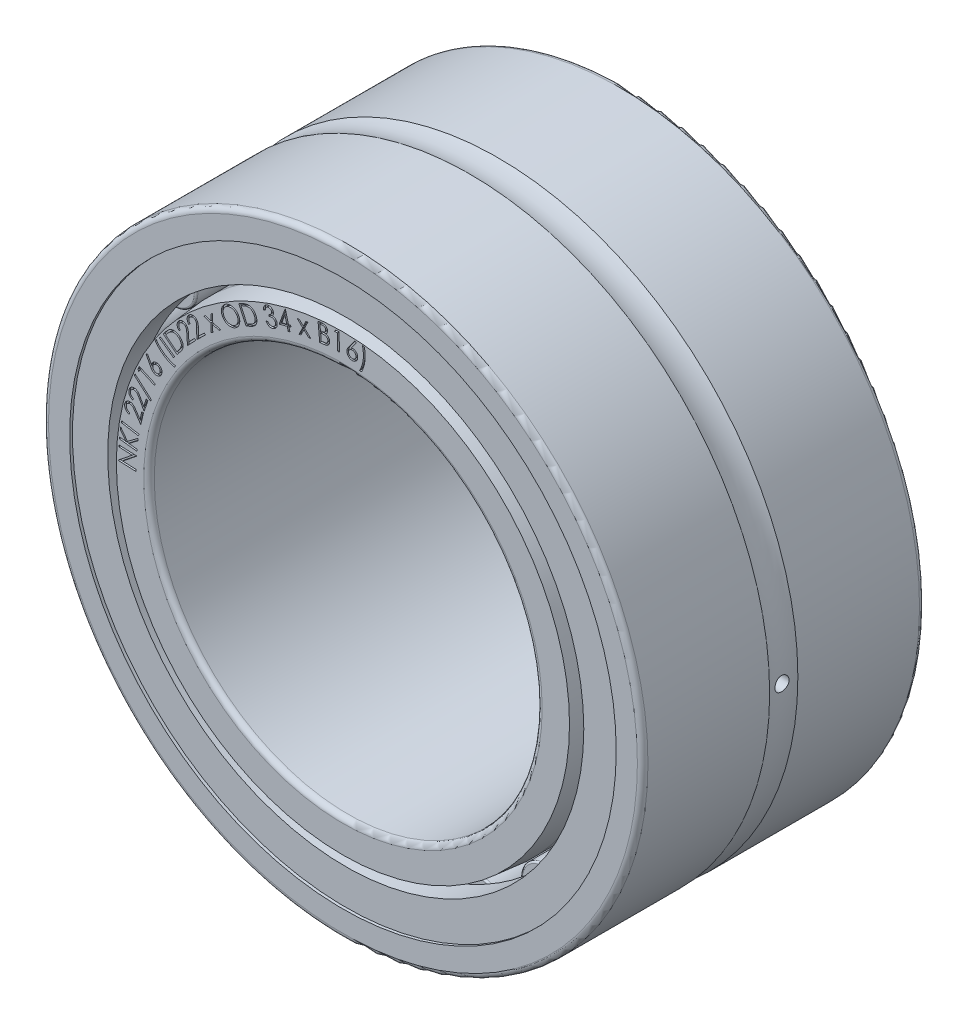
from build123d import *

# Parameters (mm, degrees)
EXTRUDE4_DEPTH    = 0.1
SKETCH5_W         = 6.551083239
SKETCH5_H         = 0.4
CIRPATTERN1_COUNT = 21


with BuildPart() as part:
    # Sketch2 → Revolve1 (revolve)
    with BuildSketch(Plane(origin=(0, 0, 0), x_dir=(0, 0, -1), z_dir=(1, 0, 0))):
        with BuildLine():
            Line((-7.7, 17), (-0.8, 17))
            ThreePointArc((-0.8, 17), (0, 16.868543856), (0.8, 17))
            Line((0.8, 17), (7.7, 17))
            ThreePointArc((7.7, 17), (7.912132034, 16.912132034), (8, 16.7))
            Line((8, 16.7), (8, 15.5))
            Line((8, 15.5), (7.84, 15.5))
            Line((7.84, 15.5), (7.84, 13.5))
            Line((7.84, 13.5), (6.4, 13.5))
            Line((6.4, 13.5), (6.4, 15.5))
            Line((6.4, 15.5), (-6.4, 15.5))
            Line((-6.4, 15.5), (-6.4, 13.5))
            Line((-6.4, 13.5), (-7.84, 13.5))
            Line((-7.84, 13.5), (-7.84, 15.5))
            Line((-7.84, 15.5), (-8, 15.5))
            Line((-8, 15.5), (-8, 16.7))
            ThreePointArc((-8, 16.7), (-7.912132034, 16.912132034), (-7.7, 17))
        make_face()
        with BuildLine():
            Line((8, 12.85), (8, 11.3))
            ThreePointArc((8, 11.3), (7.912132034, 11.087867966), (7.7, 11))
            Line((7.7, 11), (-7.7, 11))
            ThreePointArc((-7.7, 11), (-7.912132034, 11.087867966), (-8, 11.3))
            Line((-8, 11.3), (-8, 12.85))
            Line((-8, 12.85), (-6.4, 13))
            Line((-6.4, 13), (6.4, 13))
            Line((6.4, 13), (8, 12.85))
        make_face()
    revolve(axis=Axis((0, 0, 0), (0, 0, -1)))

    # Sketch4 → Extrude4 (cut)
    # profile 1 of 23: a face of its own
    with BuildSketch(Plane(origin=(0, 0, 8), x_dir=(-1, 0, 0), z_dir=(0, 0, -1))):
        Polygon((11.74498842, 0.121820916), (12.739746222, 0.16327517), (12.738861258, 0.18491487), (11.949720962, 0.814340581), (12.711266379, 0.846079511), (12.707114531, 0.944247688), (11.71235673, 0.902793434), (11.713311425, 0.880355491), (12.49256682, 0.255897683), (11.740635174, 0.224596417), align=None)
    # profile 2 of 23: a face of its own
    with BuildSketch(Plane(origin=(0, 0, 8), x_dir=(-1, 0, 0), z_dir=(0, 0, -1))):
        Polygon((12.680415055, 1.252911427), (12.669367717, 1.353587914), (12.298487347, 1.312580318), (12.625803483, 1.74798536), (12.611089413, 1.881605255), (12.219960774, 1.357631219), (11.618687115, 1.809599886), (11.633160308, 1.678603762), (12.141933508, 1.29545491), (11.68101768, 1.244606291), (11.692065018, 1.143929804), align=None)
    # profile 3 of 23: a face of its own
    with BuildSketch(Plane(origin=(0, 0, 8), x_dir=(-1, 0, 0), z_dir=(0, 0, -1))):
        Polygon((12.563464611, 2.108992431), (12.546797416, 2.206575937), (11.570863384, 2.038381607), (11.587530579, 1.940798101), align=None)
    # profile 4 of 23: a face of its own
    with BuildSketch(Plane(origin=(0, 0, 8), x_dir=(-1, 0, 0), z_dir=(0, 0, -1))):
        with BuildLine():
            Line((12.101330227, 2.831590956), (12.123607751, 2.739295473))
            add(Edge.make_bspline(
                [(12.123607751, 2.739295473), (12.135084118, 2.742715331), (12.157639412, 2.749436611), (12.189791525, 2.762586389), (12.21976552, 2.77807568), (12.247346933, 2.796023667), (12.27280281, 2.816240074), (12.295944728, 2.838807204), (12.316679432, 2.863913806), (12.335113796, 2.890941425), (12.351002929, 2.919398631), (12.363560336, 2.948955542), (12.373175239, 2.979114965), (12.379494438, 3.009973057), (12.382596607, 3.041442231), (12.382328222, 3.073499968), (12.379077216, 3.106277746), (12.374405113, 3.128062799), (12.372025466, 3.139158597)],
                knots=[0, 0, 0, 0, 1.095786329, 2.153624314, 3.174666142, 4.180348924, 5.161257991, 6.146215981, 7.133807274, 8.137183611, 9.137706767, 10.112462998, 11.072229218, 12.031041039, 12.990690445, 13.961586164, 14.961773116, 16, 16, 16, 16], degree=3))
            add(Edge.make_bspline(
                [(12.372025466, 3.139158597), (12.369133803, 3.149928972), (12.363481068, 3.17098332), (12.352010096, 3.201008986), (12.338156992, 3.228688607), (12.322013554, 3.254207468), (12.303717013, 3.277644252), (12.282786271, 3.298623104), (12.259808973, 3.317586566), (12.23448472, 3.333660031), (12.208210638, 3.34776352), (12.181116018, 3.358908767), (12.153726707, 3.367111451), (12.12603206, 3.37292611), (12.097922516, 3.375582756), (12.069482554, 3.375469174), (12.04068073, 3.372881586), (12.021678965, 3.368710574), (12.012037143, 3.366594131)],
                knots=[0, 0, 0, 0, 1.125050558, 2.199292526, 3.237757899, 4.244236822, 5.242559012, 6.232221335, 7.229724183, 8.243107121, 9.254381132, 10.236464137, 11.194383496, 12.13671734, 13.088189674, 14.038109169, 15.004502826, 16, 16, 16, 16], degree=3))
            add(Edge.make_bspline(
                [(12.012037143, 3.366594131), (11.998697392, 3.362883025), (11.972246269, 3.35552435), (11.934756274, 3.338365247), (11.899682884, 3.316829214), (11.872354577, 3.29492871), (11.851222717, 3.274150767), (11.834005445, 3.256017659), (11.816051762, 3.234917807), (11.796950709, 3.211313839), (11.776725949, 3.185071371), (11.755654438, 3.155992113), (11.733387319, 3.124331975), (11.718434682, 3.102177486), (11.710699104, 3.090716111)],
                knots=[0, 0, 0, 0, 1.187379903, 2.354431619, 3.52574279, 4.71443697, 5.351566253, 6.069546333, 6.860712945, 7.729544208, 8.676682595, 9.70507166, 10.812744683, 12, 12, 12, 12], degree=3))
            Line((11.710699104, 3.090716111), (11.51010378, 2.788367788))
            Line((11.51010378, 2.788367788), (11.402596507, 3.233034051))
            Line((11.402596507, 3.233034051), (11.309501209, 3.210550431))
            Line((11.309501209, 3.210550431), (11.467776449, 2.556403369))
            Line((11.467776449, 2.556403369), (11.776334561, 3.020580745))
            add(Edge.make_bspline(
                [(11.776334561, 3.020580745), (11.783782602, 3.031878128), (11.798085083, 3.053572504), (11.819191659, 3.084477727), (11.839145081, 3.112363439), (11.857666619, 3.137380378), (11.87444871, 3.159752899), (11.890393597, 3.178856286), (11.904905126, 3.195137354), (11.921997216, 3.213104555), (11.943881781, 3.231468143), (11.971730112, 3.249273435), (12.001238363, 3.263547168), (12.022098485, 3.269470476), (12.032584008, 3.272447879)],
                knots=[0, 0, 0, 0, 1.322290344, 2.539195293, 3.656889708, 4.672729116, 5.581051676, 6.389239792, 7.103370617, 7.712164125, 8.811421712, 9.884395145, 10.936572625, 12, 12, 12, 12], degree=3))
            add(Edge.make_bspline(
                [(12.032584008, 3.272447879), (12.039298312, 3.273898108), (12.052565788, 3.276763764), (12.07263535, 3.278429609), (12.092389902, 3.278062866), (12.111930898, 3.275932452), (12.131207983, 3.271439833), (12.150303573, 3.265155592), (12.168912598, 3.25631374), (12.187210467, 3.245963032), (12.204713209, 3.233966047), (12.220561908, 3.220190509), (12.234783846, 3.205225328), (12.247831113, 3.189317184), (12.258514441, 3.171620335), (12.268041943, 3.15293202), (12.276014811, 3.132942149), (12.279720005, 3.118893464), (12.281605324, 3.111745054)],
                knots=[0, 0, 0, 0, 0.99980896, 1.975624181, 2.925148161, 3.875020837, 4.833076023, 5.803494989, 6.797609689, 7.828679661, 8.864007906, 9.882939347, 10.881090837, 11.869430608, 12.873017792, 13.885054409, 14.923849572, 16, 16, 16, 16], degree=3))
            add(Edge.make_bspline(
                [(12.281605324, 3.111745054), (12.283223409, 3.104139687), (12.286406075, 3.089180428), (12.288751599, 3.066709963), (12.288939491, 3.044782605), (12.28716228, 3.023361228), (12.282811879, 3.002487557), (12.276462304, 2.982109448), (12.268099196, 2.962128905), (12.257235916, 2.943001617), (12.244829571, 2.924434638), (12.229995297, 2.907379892), (12.21339019, 2.89145815), (12.194762789, 2.876829186), (12.174192129, 2.863446113), (12.151761965, 2.851261827), (12.127318457, 2.840563893), (12.110143043, 2.83463375), (12.101330227, 2.831590956)],
                knots=[0, 0, 0, 0, 1.006189926, 1.979109691, 2.918893692, 3.842028119, 4.756335916, 5.673378052, 6.60228326, 7.554432072, 8.517197069, 9.488579228, 10.47428229, 11.491920409, 12.550170492, 13.648109336, 14.793229641, 16, 16, 16, 16], degree=3))
        make_face()
    # profile 5 of 23: a face of its own
    with BuildSketch(Plane(origin=(0, 0, 8), x_dir=(-1, 0, 0), z_dir=(0, 0, -1))):
        with BuildLine():
            Line((11.88429974, 3.63034929), (11.914691531, 3.540035545))
            add(Edge.make_bspline(
                [(11.914691531, 3.540035545), (11.925871935, 3.544452548), (11.947868502, 3.553142654), (11.979023874, 3.568982622), (12.007505794, 3.58728836), (12.033771867, 3.607325987), (12.057166782, 3.629986984), (12.078418712, 3.654459965), (12.097076542, 3.681279623), (12.113102372, 3.709929425), (12.126540685, 3.739783747), (12.136532317, 3.770364051), (12.143399782, 3.801324505), (12.146872255, 3.832628231), (12.147363338, 3.864388532), (12.144334666, 3.8964198), (12.138096955, 3.928878814), (12.131545394, 3.950174782), (12.128201895, 3.961042887)],
                knots=[0, 0, 0, 0, 1.096718826, 2.157708088, 3.183298192, 4.183164934, 5.167365531, 6.150320186, 7.137045587, 8.143206449, 9.14246018, 10.120073371, 11.074019571, 12.03159868, 12.98956552, 13.967786302, 14.962887668, 16, 16, 16, 16], degree=3))
            add(Edge.make_bspline(
                [(12.128201895, 3.961042887), (12.124351283, 3.971556993), (12.116814272, 3.992136822), (12.102706554, 4.021176874), (12.086457137, 4.047681451), (12.068262601, 4.071890085), (12.047759539, 4.093619238), (12.025106851, 4.112846899), (12.00039094, 4.129693294), (11.973880231, 4.143782683), (11.946248329, 4.155279135), (11.918307588, 4.164239284), (11.89021116, 4.170322364), (11.862031049, 4.173512919), (11.833683306, 4.173828021), (11.805267924, 4.171300682), (11.776752222, 4.165863353), (11.758102762, 4.160217731), (11.74863542, 4.157351748)],
                knots=[0, 0, 0, 0, 1.125745287, 2.203482374, 3.240954167, 4.248626138, 5.244160159, 6.23949025, 7.231642685, 8.246963257, 9.253717075, 10.238384561, 11.194414551, 12.140483648, 13.086171207, 14.041068069, 15.005554093, 16, 16, 16, 16], degree=3))
            add(Edge.make_bspline(
                [(11.74863542, 4.157351748), (11.735611376, 4.152463072), (11.709793753, 4.142772227), (11.673728203, 4.122421869), (11.640715303, 4.097590867), (11.61530204, 4.073331813), (11.595843916, 4.050904534), (11.580395857, 4.031155168), (11.564102339, 4.008675045), (11.547065559, 3.983381752), (11.529270022, 3.955289829), (11.510700724, 3.92444073), (11.491033013, 3.890914068), (11.478108833, 3.867392836), (11.471404629, 3.855191587)],
                knots=[0, 0, 0, 0, 1.188740345, 2.356445504, 3.527624716, 4.715211558, 5.354037005, 6.066515832, 6.859560512, 7.72877435, 8.674992572, 9.704123175, 10.809051895, 12, 12, 12, 12], degree=3))
            Line((11.471404629, 3.855191587), (11.297280225, 3.53577986))
            Line((11.297280225, 3.53577986), (11.151150833, 3.97078834))
            Line((11.151150833, 3.97078834), (11.060233045, 3.940205721))
            Line((11.060233045, 3.940205721), (11.275176558, 3.300201425))
            Line((11.275176558, 3.300201425), (11.543076483, 3.790873336))
            add(Edge.make_bspline(
                [(11.543076483, 3.790873336), (11.549583755, 3.80280473), (11.562071044, 3.825700771), (11.580465253, 3.858487282), (11.597913376, 3.888158715), (11.614210026, 3.914825786), (11.629183026, 3.938593758), (11.643568119, 3.958987682), (11.656453683, 3.976714231), (11.672123018, 3.996037785), (11.692345159, 4.016408028), (11.718648426, 4.036636603), (11.746882271, 4.053556297), (11.767288806, 4.061155591), (11.77755226, 4.064977651)],
                knots=[0, 0, 0, 0, 1.322692, 2.538212255, 3.658651727, 4.672451212, 5.579970595, 6.391789863, 7.100864854, 7.71246952, 8.811847687, 9.884627819, 10.936074864, 12, 12, 12, 12], degree=3))
            add(Edge.make_bspline(
                [(11.77755226, 4.064977651), (11.784127344, 4.067044976), (11.797089965, 4.071120656), (11.816984101, 4.074486281), (11.836762348, 4.07580388), (11.856466867, 4.075321786), (11.87609671, 4.072625672), (11.895537879, 4.067733124), (11.914968553, 4.060900724), (11.934115079, 4.051960842), (11.952628027, 4.041453274), (11.969704289, 4.029177532), (11.985330218, 4.015581143), (11.999504291, 4.000581315), (12.011998547, 3.983930368), (12.02302782, 3.965931464), (12.032753298, 3.94657413), (12.037650422, 3.932826491), (12.040136466, 3.92584745)],
                knots=[0, 0, 0, 0, 1.000044705, 1.971563961, 2.921399268, 3.87572905, 4.829122175, 5.792670853, 6.782601902, 7.815901846, 8.857676989, 9.869687508, 10.86478275, 11.861955042, 12.861011816, 13.882227035, 14.924904539, 16, 16, 16, 16], degree=3))
            add(Edge.make_bspline(
                [(12.040136466, 3.92584745), (12.04246327, 3.918467997), (12.047055833, 3.903902698), (12.051079813, 3.881691747), (12.053455695, 3.859826988), (12.053024249, 3.838263956), (12.050915857, 3.816999753), (12.046429477, 3.796010082), (12.039493566, 3.775459932), (12.030498289, 3.75529334), (12.01961056, 3.735711256), (12.006400947, 3.717189922), (11.99104589, 3.699912544), (11.973751529, 3.683678631), (11.954498282, 3.668441958), (11.933025194, 3.654457435), (11.909518009, 3.641589573), (11.892818761, 3.634146387), (11.88429974, 3.63034929)],
                knots=[0, 0, 0, 0, 0.998037158, 1.969889995, 2.908796952, 3.832983648, 4.748687311, 5.664390974, 6.597421764, 7.543779698, 8.511993126, 9.485259735, 10.474583184, 11.491505794, 12.544161045, 13.640259986, 14.796192799, 16, 16, 16, 16], degree=3))
        make_face()
    # profile 6 of 23: a face of its own
    with BuildSketch(Plane(origin=(0, 0, 8), x_dir=(-1, 0, 0), z_dir=(0, 0, -1))):
        Polygon((11.793630147, 4.894302364), (10.869112898, 4.083718824), (10.907281803, 3.987319101), (11.831911691, 4.797189213), align=None)
    # profile 7 of 23: a face of its own
    with BuildSketch(Plane(origin=(0, 0, 8), x_dir=(-1, 0, 0), z_dir=(0, 0, -1))):
        Polygon((11.631373933, 5.19893178), (11.550488759, 5.376880077), (10.644684737, 4.965122648), (10.685485084, 4.875181335), (11.502586681, 5.246658925), (11.567399208, 5.104421882), align=None)
    # profile 8 of 23: a face of its own
    with BuildSketch(Plane(origin=(0, 0, 8), x_dir=(-1, 0, 0), z_dir=(0, 0, -1))):
        with BuildLine():
            Line((11.172723162, 6.182400034), (11.086787197, 6.229232028))
            Line((11.086787197, 6.229232028), (10.853962104, 5.799397697))
            add(Edge.make_bspline(
                [(10.853962104, 5.799397697), (10.852228658, 5.808539475), (10.848855177, 5.826330411), (10.841803322, 5.851869876), (10.832994833, 5.875554647), (10.825700421, 5.890278138), (10.822119478, 5.897506134)],
                knots=[0, 0, 0, 0, 1.077678018, 2.097283379, 3.065926236, 4, 4, 4, 4], degree=3))
            add(Edge.make_bspline(
                [(10.822119478, 5.897506134), (10.817292196, 5.905967161), (10.807791439, 5.92261963), (10.791001566, 5.945616887), (10.772334449, 5.966266995), (10.751689732, 5.984543168), (10.729305864, 6.000593178), (10.705114899, 6.014519678), (10.679016091, 6.025941318), (10.651460243, 6.03510921), (10.623119174, 6.041887028), (10.594515604, 6.045583306), (10.566061308, 6.046673249), (10.537688746, 6.044828977), (10.509490462, 6.039837519), (10.481398933, 6.032195815), (10.453407744, 6.021785826), (10.435413913, 6.012686111), (10.426292725, 6.008073407)],
                knots=[0, 0, 0, 0, 1.020433826, 2.00835462, 2.977679774, 3.932852693, 4.892630115, 5.860108957, 6.853099152, 7.873364948, 8.900664339, 9.902397024, 10.891457603, 11.881112331, 12.876467613, 13.887812091, 14.929318379, 16, 16, 16, 16], degree=3))
            add(Edge.make_bspline(
                [(10.426292725, 6.008073407), (10.414093751, 6.001078883), (10.390132373, 5.987340151), (10.358554772, 5.961211679), (10.330447247, 5.93249506), (10.307226682, 5.900018899), (10.288611729, 5.864886211), (10.2746719, 5.827581171), (10.266530106, 5.788067339), (10.263088833, 5.747228798), (10.264992217, 5.705880931), (10.272043861, 5.665208978), (10.284236271, 5.625613816), (10.296376493, 5.600837944), (10.302497678, 5.588345775)],
                knots=[0, 0, 0, 0, 1.035817817, 2.034566378, 3.012450249, 3.993902146, 4.968541209, 5.939024596, 6.921687659, 7.935776136, 8.955831295, 9.966743151, 10.974817592, 12, 12, 12, 12], degree=3))
            add(Edge.make_bspline(
                [(10.302497678, 5.588345775), (10.309280211, 5.576757058), (10.322736486, 5.553765505), (10.34784002, 5.522788998), (10.376632677, 5.495552843), (10.408737565, 5.472190301), (10.443553518, 5.453105889), (10.480662952, 5.439323449), (10.519464223, 5.430577933), (10.559566877, 5.427519631), (10.599923405, 5.429003552), (10.639460927, 5.436196508), (10.677984634, 5.447637045), (10.70196971, 5.459575347), (10.714048353, 5.465587356)],
                knots=[0, 0, 0, 0, 1.009642815, 2.003091149, 2.988996086, 3.985478748, 4.983937003, 5.967995194, 6.955730636, 7.96782271, 8.987425497, 9.986655196, 10.986099783, 12, 12, 12, 12], degree=3))
            add(Edge.make_bspline(
                [(10.714048353, 5.465587356), (10.722976582, 5.470743848), (10.741169072, 5.481250908), (10.767007075, 5.500486875), (10.792062375, 5.522813544), (10.812245116, 5.543723799), (10.82827689, 5.562293794), (10.840293717, 5.578100606), (10.852958929, 5.595022229), (10.865527324, 5.613634705), (10.878152162, 5.633789445), (10.891042018, 5.655364587), (10.904175147, 5.67837741), (10.91280962, 5.694332068), (10.91724115, 5.702520588)],
                knots=[0, 0, 0, 0, 1.170792295, 2.385649655, 3.652039239, 4.980896351, 5.684861707, 6.438475264, 7.23646509, 8.086403415, 8.98944645, 9.938645574, 10.94203664, 12, 12, 12, 12], degree=3))
            Line((10.91724115, 5.702520588), (11.172723162, 6.182400034))
        make_face()
        with BuildLine():
            add(Edge.make_bspline(
                [(10.756066147, 5.835619511), (10.759280991, 5.829282157), (10.765628154, 5.816770129), (10.772650356, 5.797164236), (10.777893303, 5.777432063), (10.78093067, 5.757485765), (10.781701034, 5.737312281), (10.780705546, 5.716979848), (10.777262177, 5.696428667), (10.77221871, 5.675926267), (10.765108479, 5.655951486), (10.756356597, 5.637078009), (10.746088205, 5.619335921), (10.733960836, 5.603130448), (10.720369927, 5.58807734), (10.704890848, 5.574620985), (10.688050469, 5.562141062), (10.675749319, 5.555160204), (10.669536677, 5.551634552)],
                knots=[0, 0, 0, 0, 1.03177995, 2.037074107, 3.019440147, 3.995314868, 4.962028519, 5.948984632, 6.948030727, 7.985271795, 9.013761155, 10.023774262, 11.005037408, 11.986828179, 12.959949121, 13.946332642, 14.962804323, 16, 16, 16, 16], degree=3))
            add(Edge.make_bspline(
                [(10.669536677, 5.551634552), (10.66319953, 5.548417812), (10.650687911, 5.542066906), (10.631079034, 5.53507202), (10.611400708, 5.529739939), (10.591420743, 5.527065841), (10.571299343, 5.525840819), (10.550962756, 5.527335383), (10.530366973, 5.530273065), (10.509948877, 5.535741984), (10.489986722, 5.542758185), (10.471059278, 5.55143658), (10.453606735, 5.562028549), (10.437221494, 5.573772352), (10.422283289, 5.587406939), (10.408919006, 5.6027574), (10.396471551, 5.619439713), (10.38957489, 5.631618883), (10.386054769, 5.637835244)],
                knots=[0, 0, 0, 0, 1.034168713, 2.041790314, 3.026430714, 3.998112209, 4.972758452, 5.957158643, 6.962524582, 7.999023176, 9.029893682, 10.042245157, 11.025347205, 11.999168114, 12.974542013, 13.963209196, 14.960403021, 16, 16, 16, 16], degree=3))
            add(Edge.make_bspline(
                [(10.386054769, 5.637835244), (10.382838237, 5.644172375), (10.37648774, 5.656683962), (10.369489866, 5.676293071), (10.364168782, 5.695970545), (10.36145426, 5.715953642), (10.360381982, 5.736038867), (10.361295397, 5.756367908), (10.364756212, 5.776856468), (10.369785079, 5.797364808), (10.376925401, 5.817321809), (10.385573271, 5.836255916), (10.396173125, 5.853706738), (10.407914855, 5.870092432), (10.421549999, 5.885030516), (10.436900309, 5.898394832), (10.453582662, 5.910842278), (10.465761826, 5.91773894), (10.471978185, 5.921259061)],
                knots=[0, 0, 0, 0, 1.034454802, 2.042355147, 3.027267934, 3.999218232, 4.974134097, 5.955243654, 6.956879738, 7.996809816, 9.027965497, 10.040597026, 11.023971036, 11.998061339, 12.973705061, 13.962645746, 14.960115431, 16, 16, 16, 16], degree=3))
            add(Edge.make_bspline(
                [(10.471978185, 5.921259061), (10.478409702, 5.924488654), (10.491027718, 5.930824803), (10.510705962, 5.937924564), (10.530495964, 5.943086998), (10.55049762, 5.946452829), (10.570733718, 5.946939093), (10.591075918, 5.946087253), (10.611644179, 5.942976242), (10.632059795, 5.937550721), (10.652035208, 5.930544158), (10.670916202, 5.921784785), (10.688548479, 5.91148981), (10.704889613, 5.899665874), (10.719840296, 5.886052312), (10.733201189, 5.870696139), (10.745649555, 5.854015362), (10.752546091, 5.84183598), (10.756066147, 5.835619511)],
                knots=[0, 0, 0, 0, 1.045867035, 2.051890347, 3.034968911, 4.018047475, 4.993373957, 5.972656373, 6.976427602, 8.011282102, 9.040517442, 10.051263126, 11.033237996, 12.005514231, 12.979340992, 13.966439952, 14.962052029, 16, 16, 16, 16], degree=3))
        make_face(mode=Mode.SUBTRACT)
    # profile 9 of 23: a face of its own
    with BuildSketch(Plane(origin=(0, 0, 8), x_dir=(-1, 0, 0), z_dir=(0, 0, -1))):
        with BuildLine():
            Line((10.643544407, 7.081998943), (10.584486258, 7.173689776))
            add(Edge.make_bspline(
                [(10.584486258, 7.173689776), (10.577782258, 7.162887801), (10.564227337, 7.141047123), (10.542279558, 7.10871464), (10.518636842, 7.076412648), (10.493390704, 7.043994618), (10.466634733, 7.011370538), (10.438053917, 6.978807754), (10.407987331, 6.946065367), (10.365449106, 6.902589034), (10.309634308, 6.849425669), (10.238561144, 6.789125047), (10.163921872, 6.731800375), (10.111402844, 6.696942456), (10.084974956, 6.679401744)],
                knots=[0, 0, 0, 0, 0.646067674, 1.306294084, 1.985437056, 2.680154843, 3.394302927, 4.129429449, 4.881836118, 5.653220384, 7.2204035, 8.797256835, 10.388360557, 12, 12, 12, 12], degree=3))
            add(Edge.make_bspline(
                [(10.084974956, 6.679401744), (10.060101063, 6.663785083), (10.01080044, 6.632832505), (9.934822501, 6.590943866), (9.858339817, 6.552867234), (9.781693483, 6.51908794), (9.706096177, 6.489819662), (9.632674094, 6.465094292), (9.561805202, 6.445382362), (9.515051454, 6.436018752), (9.49230284, 6.431462771)],
                knots=[0, 0, 0, 0, 1.090502024, 2.161399792, 3.220310296, 4.262433559, 5.27072629, 6.22973788, 7.138657114, 8, 8, 8, 8], degree=3))
            Line((9.49230284, 6.431462771), (9.548384246, 6.34453006))
            add(Edge.make_bspline(
                [(9.548384246, 6.34453006), (9.570248341, 6.348880647), (9.615326197, 6.357850381), (9.683844721, 6.377117989), (9.755340834, 6.40143184), (9.82955804, 6.430063881), (9.904974301, 6.463364699), (9.980319407, 6.500985847), (10.055104839, 6.542473723), (10.103810903, 6.57293445), (10.128382039, 6.588301216)],
                knots=[0, 0, 0, 0, 0.845157082, 1.742485521, 2.696586935, 3.708341713, 4.758231949, 5.82173338, 6.901112462, 8, 8, 8, 8], degree=3))
            add(Edge.make_bspline(
                [(10.128382039, 6.588301216), (10.154509985, 6.605551879), (10.206507543, 6.639882642), (10.28070732, 6.695977977), (10.351987078, 6.754460785), (10.419343131, 6.816125882), (10.482651269, 6.879958277), (10.541561734, 6.945337008), (10.59530189, 7.01243255), (10.627576432, 7.058972897), (10.643544407, 7.081998943)],
                knots=[0, 0, 0, 0, 1.04575047, 2.081161353, 3.10583942, 4.125141656, 5.130532179, 6.108291839, 7.06406887, 8, 8, 8, 8], degree=3))
        make_face()
    # profile 10 of 23: a face of its own
    with BuildSketch(Plane(origin=(0, 0, 8), x_dir=(-1, 0, 0), z_dir=(0, 0, -1))):
        Polygon((10.414582199, 7.348087349), (10.357180072, 7.429508282), (9.543399232, 6.854278019), (9.60080136, 6.772857086), align=None)
    # profile 11 of 23: a face of its own
    with BuildSketch(Plane(origin=(0, 0, 8), x_dir=(-1, 0, 0), z_dir=(0, 0, -1))):
        with BuildLine():
            Line((9.408505192, 7.030334983), (10.187607674, 7.657367541))
            Line((10.187607674, 7.657367541), (10.057444228, 7.819061968))
            add(Edge.make_bspline(
                [(10.057444228, 7.819061968), (10.046064134, 7.833049814), (10.024081174, 7.860070174), (9.991272643, 7.898234747), (9.959843785, 7.932647259), (9.930317963, 7.963649315), (9.901883377, 7.990531035), (9.875447627, 8.014134569), (9.850319084, 8.033971713), (9.833441265, 8.045027615), (9.825461782, 8.050254617)],
                knots=[0, 0, 0, 0, 1.3161368, 2.54238502, 3.672726197, 4.717630327, 5.666309542, 6.527874098, 7.304009401, 8, 8, 8, 8], degree=3))
            add(Edge.make_bspline(
                [(9.825461782, 8.050254617), (9.814494863, 8.0566554), (9.792823092, 8.069304013), (9.759210499, 8.085423455), (9.724818206, 8.097918497), (9.690018905, 8.10801505), (9.654484209, 8.114555697), (9.618426374, 8.118777192), (9.581781365, 8.119148748), (9.544749972, 8.117132337), (9.507673134, 8.111875067), (9.470925153, 8.103664163), (9.434524568, 8.092708), (9.398736993, 8.078413015), (9.363110429, 8.061550169), (9.328125279, 8.041404772), (9.293408363, 8.018559472), (9.271247977, 8.001346102), (9.25998175, 7.992594912)],
                knots=[0, 0, 0, 0, 1.000981449, 1.978043321, 2.934085102, 3.883201693, 4.83138331, 5.779638004, 6.741950495, 7.716782909, 8.701460366, 9.690617386, 10.683201098, 11.695143329, 12.726241938, 13.788326468, 14.875596462, 16, 16, 16, 16], degree=3))
            add(Edge.make_bspline(
                [(9.25998175, 7.992594912), (9.250498499, 7.984675734), (9.23181668, 7.969075107), (9.205585246, 7.94428393), (9.18174388, 7.918464135), (9.160037708, 7.891692048), (9.140288966, 7.864230587), (9.122674288, 7.835763941), (9.107520846, 7.80632649), (9.094399081, 7.77628612), (9.083456655, 7.745958454), (9.074808215, 7.715593087), (9.06821776, 7.685526169), (9.06373504, 7.655652027), (9.06153083, 7.626064088), (9.061821666, 7.596662254), (9.064074746, 7.567505984), (9.068633877, 7.538332778), (9.076012434, 7.508825053), (9.086127612, 7.478630552), (9.099149952, 7.44738496), (9.115460118, 7.415402493), (9.134320654, 7.382245476), (9.156469068, 7.348433177), (9.181228781, 7.313367621), (9.199444879, 7.290215301), (9.208830036, 7.278286942)],
                knots=[0, 0, 0, 0, 1.090247091, 2.147765382, 3.182828215, 4.189604686, 5.187841585, 6.166277096, 7.141138775, 8.107376516, 9.0576309, 9.984386602, 10.891962773, 11.77244331, 12.648395806, 13.507534599, 14.36499414, 15.227340681, 16.110243722, 17.046135753, 18.035390837, 19.094812203, 20.212724999, 21.400426019, 22.660667612, 24, 24, 24, 24], degree=3))
            Line((9.208830036, 7.278286942), (9.408505192, 7.030334983))
        make_face()
        with BuildLine():
            Line((9.421981321, 7.164254058), (9.349459221, 7.254473499))
            add(Edge.make_bspline(
                [(9.349459221, 7.254473499), (9.339117421, 7.267421539), (9.319192559, 7.292367675), (9.29140724, 7.328886895), (9.266676001, 7.362868357), (9.245011999, 7.39409055), (9.22634315, 7.422712529), (9.211237175, 7.448978332), (9.198474979, 7.472319903), (9.192189943, 7.487541903), (9.189287673, 7.494571036)],
                knots=[0, 0, 0, 0, 1.373798053, 2.646806093, 3.803960613, 4.857826896, 5.797326814, 6.635603622, 7.369956397, 8, 8, 8, 8], degree=3))
            add(Edge.make_bspline(
                [(9.189287673, 7.494571036), (9.186007088, 7.503777986), (9.179537328, 7.521935348), (9.172697204, 7.549788378), (9.167916301, 7.577573914), (9.165842542, 7.605435106), (9.165829794, 7.633217193), (9.16835305, 7.660962975), (9.173419467, 7.688604836), (9.180610639, 7.716166851), (9.190143906, 7.743384973), (9.202423119, 7.769814992), (9.216552209, 7.795665046), (9.233249064, 7.820605386), (9.251952137, 7.845002934), (9.273507738, 7.86825468), (9.296749936, 7.891286279), (9.313820947, 7.905443776), (9.322490908, 7.912634032)],
                knots=[0, 0, 0, 0, 0.994090734, 1.960482581, 2.914467012, 3.860211464, 4.799955794, 5.738913604, 6.691129668, 7.656661055, 8.635232249, 9.621464988, 10.619287994, 11.630168215, 12.672887875, 13.744156541, 14.854310671, 16, 16, 16, 16], degree=3))
            add(Edge.make_bspline(
                [(9.322490908, 7.912634032), (9.331870689, 7.919954742), (9.350263669, 7.934310052), (9.379189578, 7.953034265), (9.408088243, 7.969834385), (9.437774773, 7.983299165), (9.467514906, 7.994923996), (9.4976532, 8.003789006), (9.528208585, 8.009866169), (9.558885795, 8.013673148), (9.589574773, 8.014788294), (9.619943118, 8.013311492), (9.649899419, 8.009348522), (9.67924316, 8.002382126), (9.708146344, 7.993351184), (9.736423459, 7.981334322), (9.764188814, 7.966637329), (9.78203056, 7.955180075), (9.791078116, 7.949370098)],
                knots=[0, 0, 0, 0, 1.127139665, 2.210228264, 3.262995644, 4.29208112, 5.296069419, 6.287553661, 7.2649, 8.245723358, 9.21432254, 10.171525063, 11.124366158, 12.073669934, 13.026511029, 13.991049502, 14.981260499, 16, 16, 16, 16], degree=3))
            add(Edge.make_bspline(
                [(9.791078116, 7.949370098), (9.798210247, 7.944323894), (9.813439956, 7.933548406), (9.836074524, 7.914199508), (9.860658583, 7.891578648), (9.886851931, 7.865360288), (9.914681277, 7.835602855), (9.94415715, 7.802364694), (9.975616715, 7.765868641), (9.996586568, 7.739880921), (10.007458546, 7.726407393)],
                knots=[0, 0, 0, 0, 0.672565278, 1.436172802, 2.290918142, 3.245427547, 4.289521529, 5.428368202, 6.666718261, 8, 8, 8, 8], degree=3))
            Line((10.007458546, 7.726407393), (10.051734175, 7.671283054))
            Line((10.051734175, 7.671283054), (9.421981321, 7.164254058))
        make_face(mode=Mode.SUBTRACT)
    # profile 12 of 23: a face of its own
    with BuildSketch(Plane(origin=(0, 0, 8), x_dir=(-1, 0, 0), z_dir=(0, 0, -1))):
        with BuildLine():
            Line((9.229180189, 8.324037776), (9.295341368, 8.254873405))
            add(Edge.make_bspline(
                [(9.295341368, 8.254873405), (9.303689228, 8.263596971), (9.320071084, 8.280716115), (9.341223603, 8.308693601), (9.359477554, 8.337305351), (9.374797571, 8.366764013), (9.386424374, 8.397336184), (9.395370261, 8.428689812), (9.400623881, 8.461056232), (9.403154878, 8.493886118), (9.402355962, 8.526683084), (9.398583479, 8.558770647), (9.391547313, 8.589839432), (9.38157637, 8.619888238), (9.368402918, 8.648852845), (9.351982703, 8.676674453), (9.332618083, 8.703536589), (9.317583421, 8.720130353), (9.309970042, 8.728533244)],
                knots=[0, 0, 0, 0, 1.097280787, 2.153305925, 3.183183787, 4.181497573, 5.166854025, 6.152977385, 7.141528475, 8.143529353, 9.143596203, 10.120212636, 11.077031123, 12.035582385, 12.994710542, 13.964886594, 14.969442031, 16, 16, 16, 16], degree=3))
            add(Edge.make_bspline(
                [(9.309970042, 8.728533244), (9.302007617, 8.736467184), (9.286430313, 8.751988762), (9.261143271, 8.772230658), (9.235066007, 8.789360271), (9.208195577, 8.80362737), (9.180309988, 8.814574164), (9.151559538, 8.822425715), (9.121908648, 8.826982512), (9.091752388, 8.828681607), (9.061772724, 8.827215024), (9.032583418, 8.823468773), (9.004579558, 8.816903045), (8.9776033, 8.807792295), (8.951676165, 8.796212452), (8.927116683, 8.781551132), (8.903424143, 8.764718552), (8.888949285, 8.751565753), (8.881604965, 8.744892225)],
                knots=[0, 0, 0, 0, 1.126528986, 2.203886986, 3.24123734, 4.251524, 5.248947637, 6.239085032, 7.233898079, 8.251767273, 9.26258634, 10.239595469, 11.199077828, 12.14165906, 13.091301278, 14.040353151, 15.005705384, 16, 16, 16, 16], degree=3))
            add(Edge.make_bspline(
                [(8.881604965, 8.744892225), (8.871862624, 8.734937864), (8.852504001, 8.715157943), (8.828507191, 8.681282869), (8.809102169, 8.644697133), (8.796244421, 8.611911419), (8.788333938, 8.583155306), (8.782671531, 8.558619217), (8.7774756, 8.531306908), (8.772541032, 8.501120728), (8.768416558, 8.468045723), (8.764571022, 8.432094473), (8.761070816, 8.39337408), (8.75936764, 8.366581424), (8.758486486, 8.352719979)],
                knots=[0, 0, 0, 0, 1.187360288, 2.359356875, 3.527689489, 4.715596759, 5.356064294, 6.07189626, 6.864328734, 7.728596333, 8.68206479, 9.708693246, 10.814569835, 12, 12, 12, 12], degree=3))
            Line((8.758486486, 8.352719979), (8.736227573, 7.988004694))
            Line((8.736227573, 7.988004694), (8.418180625, 8.32070862))
            Line((8.418180625, 8.32070862), (8.348589285, 8.254174985))
            Line((8.348589285, 8.254174985), (8.816573106, 7.764673652))
            Line((8.816573106, 7.764673652), (8.85093358, 8.324530578))
            add(Edge.make_bspline(
                [(8.85093358, 8.324530578), (8.851768519, 8.338126983), (8.853372912, 8.364253435), (8.856082016, 8.40182058), (8.859176625, 8.436153785), (8.862749764, 8.467232925), (8.866344044, 8.495186688), (8.870453341, 8.519874904), (8.874629497, 8.541451294), (8.880722249, 8.565665159), (8.890286873, 8.592849008), (8.90554456, 8.622611341), (8.924145396, 8.649965009), (8.939399962, 8.665709158), (8.947016669, 8.673570317)],
                knots=[0, 0, 0, 0, 1.321148036, 2.538679214, 3.652876134, 4.664170245, 5.572701095, 6.385940052, 7.091214976, 7.70347552, 8.806550243, 9.877152041, 10.940047891, 12, 12, 12, 12], degree=3))
            add(Edge.make_bspline(
                [(8.947016669, 8.673570317), (8.952109179, 8.678227984), (8.96214755, 8.687409193), (8.978872949, 8.698893349), (8.996117615, 8.708835143), (9.014285331, 8.716739139), (9.033302022, 8.722452717), (9.053140304, 8.72634053), (9.073785636, 8.728294597), (9.094962956, 8.728480674), (9.116212551, 8.726615133), (9.137017965, 8.722853964), (9.157020255, 8.716959414), (9.176359487, 8.709487811), (9.19480033, 8.699751798), (9.212312643, 8.687885498), (9.229489174, 8.674641464), (9.23976474, 8.664185776), (9.244984468, 8.658874552)],
                knots=[0, 0, 0, 0, 0.997214486, 1.965712114, 2.927490865, 3.873620352, 4.824422596, 5.794460427, 6.793310956, 7.820120608, 8.853858298, 9.874698737, 10.87317555, 11.866029736, 12.869354004, 13.881750775, 14.92398305, 16, 16, 16, 16], degree=3))
            add(Edge.make_bspline(
                [(9.244984468, 8.658874552), (9.250259736, 8.653134559), (9.260606173, 8.641876653), (9.273907385, 8.623495912), (9.285010787, 8.604460255), (9.294301781, 8.584892857), (9.301115712, 8.564580616), (9.306055698, 8.543633172), (9.30845405, 8.521962379), (9.309028225, 8.499815471), (9.307239915, 8.477476833), (9.303401922, 8.455027917), (9.29668109, 8.432810739), (9.287978265, 8.410577997), (9.276684673, 8.388653863), (9.263351889, 8.366702696), (9.247271996, 8.345121672), (9.235312632, 8.331184424), (9.229180189, 8.324037776)],
                knots=[0, 0, 0, 0, 1.002176353, 1.965578367, 2.911397516, 3.834117939, 4.746586712, 5.662284044, 6.59727644, 7.546016294, 8.508077188, 9.475605793, 10.469688173, 11.488366573, 12.542916336, 13.637865387, 14.788760496, 16, 16, 16, 16], degree=3))
        make_face()
    # profile 13 of 23: a face of its own
    with BuildSketch(Plane(origin=(0, 0, 8), x_dir=(-1, 0, 0), z_dir=(0, 0, -1))):
        with BuildLine():
            Line((8.670658657, 8.906474977), (8.740030528, 8.841008997))
            add(Edge.make_bspline(
                [(8.740030528, 8.841008997), (8.747834592, 8.850195119), (8.763184323, 8.868263206), (8.78302244, 8.897102171), (8.799760486, 8.926633014), (8.813509408, 8.956829836), (8.823495237, 8.987973008), (8.830705687, 9.01970065), (8.834374327, 9.05224411), (8.835145915, 9.085149898), (8.832613815, 9.117852673), (8.827318505, 9.149678969), (8.818664022, 9.180342371), (8.806962226, 9.209729109), (8.792216747, 9.237893366), (8.774550698, 9.26482614), (8.753820801, 9.290610834), (8.737893655, 9.306285856), (8.729789039, 9.314262178)],
                knots=[0, 0, 0, 0, 1.09660024, 2.15689157, 3.180163493, 4.183383613, 5.170942533, 6.151914713, 7.140221471, 8.146676726, 9.143524785, 10.121460855, 11.078704393, 12.037798497, 12.995562868, 13.967303232, 14.965650993, 16, 16, 16, 16], degree=3))
            add(Edge.make_bspline(
                [(8.729789039, 9.314262178), (8.721427963, 9.321779889), (8.705090129, 9.336469758), (8.678856593, 9.355362974), (8.651937513, 9.371029911), (8.624461559, 9.384006207), (8.595923989, 9.393094329), (8.566877444, 9.3997078), (8.53703411, 9.40281216), (8.506843905, 9.40257856), (8.476992344, 9.3997332), (8.448135234, 9.394245822), (8.420461864, 9.386576236), (8.394136181, 9.375963151), (8.368938616, 9.36289043), (8.344988152, 9.347263247), (8.32225066, 9.329167767), (8.308554126, 9.315291304), (8.301629682, 9.308275895)],
                knots=[0, 0, 0, 0, 1.128243563, 2.204627054, 3.238415078, 4.252296433, 5.248199108, 6.239034695, 7.238653396, 8.252734201, 9.265573346, 10.245095674, 11.198389733, 12.143896838, 13.089356411, 14.043946042, 15.011093988, 16, 16, 16, 16], degree=3))
            add(Edge.make_bspline(
                [(8.301629682, 9.308275895), (8.292463608, 9.297759322), (8.274249337, 9.276861422), (8.251914072, 9.241800987), (8.234240778, 9.2042386), (8.223468388, 9.17072439), (8.216722541, 9.141714559), (8.212698232, 9.116926489), (8.208693835, 9.08941429), (8.205719691, 9.058999936), (8.203238608, 9.025779562), (8.201261366, 8.98972734), (8.200233159, 8.950891762), (8.199771307, 8.924084097), (8.19953241, 8.910217618)],
                knots=[0, 0, 0, 0, 1.189580338, 2.363862401, 3.534833324, 4.724577531, 5.361182759, 6.07597539, 6.867452309, 7.734265697, 8.683880621, 9.711201515, 10.816100757, 12, 12, 12, 12], degree=3))
            Line((8.19953241, 8.910217618), (8.19648974, 8.545517342))
            Line((8.19648974, 8.545517342), (7.861834623, 8.86077252))
            Line((7.861834623, 8.86077252), (7.795806787, 8.790762975))
            Line((7.795806787, 8.790762975), (8.28838638, 8.326920456))
            Line((8.28838638, 8.326920456), (8.293315932, 8.887241511))
            add(Edge.make_bspline(
                [(8.293315932, 8.887241511), (8.293425622, 8.900833253), (8.293636451, 8.926957048), (8.294496163, 8.964546669), (8.295626048, 8.998964674), (8.297500057, 9.030190872), (8.299694448, 9.058176372), (8.302265588, 9.0830012), (8.30550285, 9.104624386), (8.310167461, 9.129112152), (8.318512407, 9.156659003), (8.332004343, 9.187099596), (8.349270486, 9.215240372), (8.36357858, 9.231702011), (8.370778615, 9.239985741)],
                knots=[0, 0, 0, 0, 1.321234884, 2.539458745, 3.654865639, 4.668477971, 5.579997688, 6.383527219, 7.093912174, 7.704776725, 8.805583622, 9.88271282, 10.934551074, 12, 12, 12, 12], degree=3))
            add(Edge.make_bspline(
                [(8.370778615, 9.239985741), (8.375666681, 9.244886264), (8.385267233, 9.254511285), (8.401181403, 9.267065338), (8.417920798, 9.277739665), (8.435623327, 9.286648728), (8.454305489, 9.293322512), (8.473844245, 9.298492343), (8.494311651, 9.301536525), (8.515464533, 9.302578852), (8.53675022, 9.30206338), (8.557670455, 9.299284939), (8.577964414, 9.294799135), (8.597548457, 9.288137548), (8.616478513, 9.279467391), (8.634621287, 9.268580715), (8.652437037, 9.256202414), (8.663271483, 9.246349705), (8.668761497, 9.241357154)],
                knots=[0, 0, 0, 0, 1.001688258, 1.967395818, 2.928249571, 3.872958319, 4.830692725, 5.796012879, 6.795832314, 7.820912673, 8.860126491, 9.874754058, 10.872326284, 11.865388837, 12.864834088, 13.88134925, 14.926440336, 16, 16, 16, 16], degree=3))
            add(Edge.make_bspline(
                [(8.668761497, 9.241357154), (8.674305501, 9.235843075), (8.685146993, 9.2250601), (8.699415412, 9.207461788), (8.7116629, 9.18918579), (8.721783262, 9.170053661), (8.729643958, 9.150133777), (8.735669252, 9.129495359), (8.739378121, 9.108056437), (8.740964742, 9.085969403), (8.740367948, 9.0635453), (8.737595376, 9.040956969), (8.732341716, 9.018427725), (8.72455908, 8.995983687), (8.714771598, 8.973406559), (8.702421248, 8.950917718), (8.687714879, 8.928397047), (8.67644679, 8.913914365), (8.670658657, 8.906474977)],
                knots=[0, 0, 0, 0, 1.00644193, 1.968132165, 2.912126781, 3.835928782, 4.749669472, 5.665633133, 6.600100557, 7.546090729, 8.51307239, 9.484555745, 10.472157671, 11.486249087, 12.540071873, 13.637585381, 14.786487258, 16, 16, 16, 16], degree=3))
        make_face()
    # profile 14 of 23: a face of its own
    with BuildSketch(Plane(origin=(0, 0, 8), x_dir=(-1, 0, 0), z_dir=(0, 0, -1))):
        Polygon((7.897734477, 9.671505666), (7.807297642, 9.74060993), (7.486368227, 9.642061842), (7.496770092, 9.977598921), (7.406089579, 10.046847675), (7.394001316, 9.615151089), (6.933191067, 9.479825283), (7.024846296, 9.40999857), (7.392459407, 9.519235261), (7.380935131, 9.137924789), (7.471078691, 9.069159099), (7.483901198, 9.546529888), align=None)
    # profile 15 of 23: a face of its own
    with BuildSketch(Plane(origin=(0, 0, 8), x_dir=(-1, 0, 0), z_dir=(0, 0, -1))):
        with BuildLine():
            add(Edge.make_bspline(
                [(6.65091698, 10.879865767), (6.635060778, 10.889134785), (6.603861137, 10.907373075), (6.554857587, 10.928744177), (6.50553925, 10.945444437), (6.45564067, 10.956845283), (6.405167574, 10.962791747), (6.354190491, 10.963461363), (6.302725063, 10.959115063), (6.251389577, 10.949300568), (6.201271283, 10.935241405), (6.153451786, 10.916560821), (6.108544605, 10.893481454), (6.066615825, 10.865877362), (6.027361397, 10.834299903), (5.991589685, 10.797836617), (5.958112372, 10.757583304), (5.938890838, 10.727897933), (5.929121973, 10.712811083)],
                knots=[0, 0, 0, 0, 1.065422536, 2.096391055, 3.096938362, 4.084607802, 5.061885061, 6.041680605, 7.039393079, 8.054854337, 9.071254773, 10.057127397, 11.030082359, 11.996676982, 12.96673197, 13.948633903, 14.95744431, 16, 16, 16, 16], degree=3))
            add(Edge.make_bspline(
                [(5.929121973, 10.712811083), (5.920140728, 10.697407205), (5.902474497, 10.667107567), (5.881985614, 10.619300785), (5.86584642, 10.571084317), (5.855241231, 10.521975894), (5.849876899, 10.47215954), (5.849300068, 10.421687777), (5.854377881, 10.370491479), (5.864004403, 10.319154485), (5.878439018, 10.268944503), (5.89735507, 10.221175897), (5.920447201, 10.176308792), (5.947678858, 10.134293398), (5.979323213, 10.095291643), (6.015387508, 10.059554091), (6.055367204, 10.026332875), (6.084806435, 10.007282863), (6.099770193, 9.997599873)],
                knots=[0, 0, 0, 0, 1.04419441, 2.053944696, 3.041920981, 4.020559223, 4.992034532, 5.974133285, 6.97340083, 8.002383606, 9.031634277, 10.030495558, 11.008899011, 11.984394241, 12.959952273, 13.946377062, 14.956157684, 16, 16, 16, 16], degree=3))
            add(Edge.make_bspline(
                [(6.099770193, 9.997599873), (6.115393121, 9.988522443), (6.146093191, 9.970684701), (6.19431971, 9.949583907), (6.242997017, 9.933445823), (6.292400797, 9.922573166), (6.342456348, 9.91689334), (6.393171873, 9.916325232), (6.444442674, 9.921125787), (6.4956904, 9.930714262), (6.545704551, 9.945114732), (6.593458075, 9.963717488), (6.63823245, 9.986556501), (6.68007164, 10.01342643), (6.718655842, 10.044759695), (6.754231806, 10.080189431), (6.787247492, 10.119521021), (6.805992352, 10.148596335), (6.815488989, 10.163326648)],
                knots=[0, 0, 0, 0, 1.059334556, 2.081661245, 3.081678283, 4.06376398, 5.043784859, 6.032132291, 7.033835959, 8.060065573, 9.086474618, 10.082801828, 11.062164806, 12.030425654, 12.994628522, 13.972172142, 14.972649452, 16, 16, 16, 16], degree=3))
            add(Edge.make_bspline(
                [(6.815488989, 10.163326648), (6.821476277, 10.173475399), (6.833382745, 10.193657452), (6.84867263, 10.225059464), (6.861863857, 10.256948238), (6.873004479, 10.289346574), (6.881980195, 10.322358902), (6.888489319, 10.356028169), (6.893004239, 10.390188288), (6.895522325, 10.424744036), (6.895552803, 10.459310733), (6.893646369, 10.493478332), (6.889158065, 10.52707395), (6.882814528, 10.560108828), (6.873897556, 10.59253464), (6.863258019, 10.624423985), (6.850002761, 10.65563713), (6.834748528, 10.686164336), (6.817518591, 10.715589745), (6.798748514, 10.74378951), (6.77831785, 10.770395352), (6.75607361, 10.795423666), (6.732312885, 10.818993176), (6.706636221, 10.840788145), (6.679755626, 10.861520995), (6.660558496, 10.873732629), (6.65091698, 10.879865767)],
                knots=[0, 0, 0, 0, 1.037053721, 2.062310171, 3.07170234, 4.073723637, 5.076572338, 6.08098779, 7.090431314, 8.108720282, 9.128908032, 10.131687809, 11.119117302, 12.110737792, 13.090807546, 14.077676894, 15.068251297, 16.073578127, 17.080227563, 18.068304327, 19.054192656, 20.0308714, 21.014302902, 21.997892527, 22.994466935, 24, 24, 24, 24], degree=3))
        make_face()
        with BuildLine():
            add(Edge.make_bspline(
                [(6.596251823, 10.799645245), (6.60387226, 10.794692087), (6.619007042, 10.784854729), (6.640557207, 10.768487103), (6.660931902, 10.750859037), (6.680034824, 10.731784194), (6.697738563, 10.711284324), (6.71444628, 10.689587095), (6.729642216, 10.666379928), (6.743779585, 10.642143464), (6.756277368, 10.617038238), (6.766973452, 10.591328482), (6.776126391, 10.565392583), (6.783440039, 10.53907106), (6.788494857, 10.512317744), (6.792040354, 10.485261936), (6.794137943, 10.457819804), (6.793834199, 10.430134083), (6.792256017, 10.402448151), (6.788550815, 10.374994114), (6.782720391, 10.347970299), (6.775633639, 10.321042668), (6.76627015, 10.294579679), (6.755410652, 10.26828926), (6.742496539, 10.242414967), (6.732590311, 10.225664892), (6.727573313, 10.217181837)],
                knots=[0, 0, 0, 0, 0.985205224, 1.956694376, 2.93141555, 3.904522055, 4.880855228, 5.866459412, 6.871470796, 7.88634361, 8.907292944, 9.9095885, 10.903797507, 11.887831515, 12.868423668, 13.853176542, 14.845670552, 15.849533829, 16.852796435, 17.851030649, 18.849474885, 19.848837449, 20.86793677, 21.890425225, 22.931608445, 24, 24, 24, 24], degree=3))
            add(Edge.make_bspline(
                [(6.727573313, 10.217181837), (6.719707297, 10.20503266), (6.704245047, 10.18115099), (6.677422413, 10.148675339), (6.648465954, 10.119555841), (6.616920495, 10.094093743), (6.583098125, 10.071841974), (6.546794595, 10.053169707), (6.508149186, 10.03812838), (6.467810317, 10.026508982), (6.426569903, 10.018691132), (6.38545809, 10.014835396), (6.344926645, 10.014988374), (6.305110162, 10.019424507), (6.265868676, 10.027731413), (6.227382428, 10.040276512), (6.189464902, 10.056811711), (6.165353947, 10.070727075), (6.153091657, 10.077804116)],
                knots=[0, 0, 0, 0, 1.054779278, 2.073382436, 3.065174146, 4.045058873, 5.024350505, 6.012897085, 7.016407255, 8.044015186, 9.070168252, 10.073016538, 11.050999668, 12.020740211, 12.989697917, 13.971069856, 14.9681317, 16, 16, 16, 16], degree=3))
            add(Edge.make_bspline(
                [(6.153091657, 10.077804116), (6.145069889, 10.082915647), (6.129161814, 10.093052393), (6.10670805, 10.110099273), (6.085366277, 10.128051285), (6.065779765, 10.147582294), (6.047232075, 10.167912353), (6.030206307, 10.189647425), (6.014566804, 10.212606659), (6.000362257, 10.236677409), (5.987784412, 10.261510737), (5.976950149, 10.286871912), (5.967978085, 10.3126636), (5.960835701, 10.33877587), (5.955256647, 10.365321634), (5.951849789, 10.392244067), (5.949843963, 10.419565932), (5.95016635, 10.447112898), (5.952134008, 10.474695501), (5.955887977, 10.50210808), (5.961127721, 10.529275386), (5.968842536, 10.555889271), (5.977731675, 10.582407611), (5.988897916, 10.608418874), (6.001485078, 10.63434114), (6.011396183, 10.650923981), (6.016406251, 10.659306615)],
                knots=[0, 0, 0, 0, 1.027346658, 2.037345015, 3.043548167, 4.038304997, 5.023571335, 6.015472185, 7.018644403, 8.023164833, 9.033266261, 10.024327095, 11.000783916, 11.981390006, 12.947665077, 13.928987529, 14.91139679, 15.905368388, 16.902685997, 17.897442827, 18.893506999, 19.888970007, 20.889102106, 21.91355661, 22.945301977, 24, 24, 24, 24], degree=3))
            add(Edge.make_bspline(
                [(6.016406251, 10.659306615), (6.021560779, 10.667517892), (6.03176699, 10.683776615), (6.049121044, 10.70652825), (6.067151283, 10.728130137), (6.086553207, 10.74800336), (6.106883811, 10.766383565), (6.128217216, 10.783378527), (6.150951839, 10.798507417), (6.174453646, 10.812617973), (6.199049125, 10.824629784), (6.22399246, 10.835454685), (6.249678997, 10.84394782), (6.275793228, 10.851246338), (6.302614732, 10.856416754), (6.330016273, 10.859879709), (6.357944104, 10.861674148), (6.386215151, 10.861580854), (6.414487173, 10.860039878), (6.442357251, 10.856596636), (6.469626865, 10.85147157), (6.496201203, 10.844616929), (6.522166796, 10.836009902), (6.547520879, 10.825658785), (6.572326885, 10.813583516), (6.588248394, 10.80430791), (6.596251823, 10.799645245)],
                knots=[0, 0, 0, 0, 1.050955128, 2.080941462, 3.100384553, 4.101162126, 5.090131322, 6.071541271, 7.056045812, 8.049881856, 9.042133507, 10.02247409, 10.99648152, 11.973687492, 12.961489324, 13.95577382, 14.967574336, 15.994322233, 17.020226973, 18.03660445, 19.037617817, 20.027541105, 21.010792976, 22.002092776, 22.995691322, 24, 24, 24, 24], degree=3))
        make_face(mode=Mode.SUBTRACT)
    # profile 16 of 23: a face of its own
    with BuildSketch(Plane(origin=(0, 0, 8), x_dir=(-1, 0, 0), z_dir=(0, 0, -1))):
        with BuildLine():
            Line((5.48573884, 10.384196364), (5.913807947, 11.285915199))
            Line((5.913807947, 11.285915199), (5.726930526, 11.374602989))
            add(Edge.make_bspline(
                [(5.726930526, 11.374602989), (5.710608303, 11.382210169), (5.67909451, 11.396897575), (5.633067094, 11.417114584), (5.589943358, 11.434443816), (5.549905318, 11.449283065), (5.512745891, 11.461264097), (5.478552276, 11.470581852), (5.447321893, 11.47745468), (5.427377878, 11.480103771), (5.417963729, 11.481354218)],
                knots=[0, 0, 0, 0, 1.316789564, 2.542364119, 3.675504318, 4.714791654, 5.664127668, 6.529349345, 7.305810635, 8, 8, 8, 8], degree=3))
            add(Edge.make_bspline(
                [(5.417963729, 11.481354218), (5.405331818, 11.48241417), (5.380410268, 11.484505354), (5.343189604, 11.484224801), (5.306845965, 11.480976258), (5.271268715, 11.474567611), (5.23642353, 11.465489206), (5.202516441, 11.452960731), (5.169178465, 11.438062724), (5.137067941, 11.419757847), (5.105925446, 11.399038813), (5.076491543, 11.375574597), (5.048527655, 11.349904334), (5.022373121, 11.321634215), (4.997822819, 11.290963753), (4.975095928, 11.257651462), (4.95388872, 11.222066867), (4.9414245, 11.196964842), (4.935111116, 11.18425015)],
                knots=[0, 0, 0, 0, 1.00140491, 1.975675975, 2.937360424, 3.88165788, 4.829575771, 5.779122754, 6.735216601, 7.712170827, 8.696494326, 9.688609629, 10.683863747, 11.693728595, 12.729257817, 13.785752778, 14.878438221, 16, 16, 16, 16], degree=3))
            add(Edge.make_bspline(
                [(4.935111116, 11.18425015), (4.930001173, 11.173018193), (4.919939406, 11.150901832), (4.907267626, 11.117228491), (4.897129767, 11.083695018), (4.888926128, 11.050305146), (4.883429336, 11.016971161), (4.879923931, 10.983797201), (4.878713512, 10.950785021), (4.880172339, 10.918103751), (4.883248947, 10.886073689), (4.888787024, 10.855119388), (4.89579823, 10.82524813), (4.904677701, 10.796533936), (4.915828271, 10.769121151), (4.928454812, 10.742674325), (4.943470427, 10.717633064), (4.959997606, 10.693262159), (4.979418949, 10.669986732), (5.001720223, 10.64724533), (5.026927749, 10.624788808), (5.055446672, 10.60301775), (5.086851016, 10.581464133), (5.121438488, 10.56056833), (5.159048598, 10.5399768), (5.1854282, 10.527029819), (5.199024128, 10.520357005)],
                knots=[0, 0, 0, 0, 1.091322642, 2.148876127, 3.179548525, 4.188722527, 5.187977987, 6.165436719, 7.137993366, 8.106830166, 9.057253145, 9.982152254, 10.886009318, 11.770198846, 12.637517425, 13.501773542, 14.359688974, 15.21778738, 16.104085338, 17.036834653, 18.033205598, 19.087570863, 20.208416199, 21.400925763, 22.66044892, 24, 24, 24, 24], degree=3))
            Line((5.199024128, 10.520357005), (5.48573884, 10.384196364))
        make_face()
        with BuildLine():
            Line((5.43979889, 10.51032509), (5.335631978, 10.559748965))
            add(Edge.make_bspline(
                [(5.335631978, 10.559748965), (5.320688161, 10.566918391), (5.291926829, 10.580716891), (5.251061817, 10.601473414), (5.214023895, 10.62114172), (5.18118171, 10.640126405), (5.152041867, 10.657871544), (5.12683614, 10.674665794), (5.105471962, 10.690528663), (5.093146493, 10.701454775), (5.087441089, 10.706512423)],
                knots=[0, 0, 0, 0, 1.375330506, 2.647003649, 3.803144433, 4.854707295, 5.794411159, 6.633727161, 7.367558519, 8, 8, 8, 8], degree=3))
            add(Edge.make_bspline(
                [(5.087441089, 10.706512423), (5.080517612, 10.713369973), (5.066850628, 10.726906815), (5.04846678, 10.748769559), (5.032262277, 10.771664539), (5.018342172, 10.795652647), (5.006458598, 10.820630522), (4.996531076, 10.846538529), (4.988939428, 10.873540082), (4.983654003, 10.901453062), (4.980557291, 10.930022241), (4.979774641, 10.95903538), (4.981386428, 10.988415771), (4.98512309, 11.018183945), (4.992041019, 11.048109754), (5.000608162, 11.078463724), (5.01175381, 11.109166766), (5.020918265, 11.12933853), (5.02559048, 11.139622482)],
                knots=[0, 0, 0, 0, 0.994249481, 1.962653896, 2.911212499, 3.853876326, 4.789764892, 5.731812558, 6.682327963, 7.648619529, 8.628255031, 9.612432039, 10.607498784, 11.629236783, 12.670318087, 13.739139416, 14.847369875, 16, 16, 16, 16], degree=3))
            add(Edge.make_bspline(
                [(5.02559048, 11.139622482), (5.030875667, 11.150210739), (5.041279024, 11.171052653), (5.05880666, 11.200675162), (5.078065026, 11.227963365), (5.098560823, 11.253230641), (5.120240498, 11.2765471), (5.143716147, 11.297346791), (5.168361361, 11.316290188), (5.194500589, 11.332891451), (5.22159864, 11.347298408), (5.249460134, 11.359353301), (5.278199693, 11.368319396), (5.307422581, 11.375415871), (5.337484293, 11.379373244), (5.368110887, 11.380989635), (5.399448314, 11.379920624), (5.420396074, 11.377348079), (5.431038653, 11.376041088)],
                knots=[0, 0, 0, 0, 1.123258163, 2.211020235, 3.263883567, 4.291149458, 5.297967743, 6.282588911, 7.265249086, 8.246108242, 9.218511646, 10.176488537, 11.123220164, 12.073362606, 13.027956674, 13.997027616, 14.982383149, 16, 16, 16, 16], degree=3))
            add(Edge.make_bspline(
                [(5.431038653, 11.376041088), (5.439617607, 11.374540662), (5.457949262, 11.371334526), (5.486746291, 11.363886917), (5.518680441, 11.354328131), (5.553600691, 11.342156414), (5.591437314, 11.32752558), (5.632329598, 11.310510877), (5.676288712, 11.291046241), (5.706514229, 11.27692258), (5.722206484, 11.269589964)],
                knots=[0, 0, 0, 0, 0.672010889, 1.435964307, 2.293961338, 3.244677588, 4.289471154, 5.424868948, 6.663062891, 8, 8, 8, 8], degree=3))
            Line((5.722206484, 11.269589964), (5.785889615, 11.239335827))
            Line((5.785889615, 11.239335827), (5.43979889, 10.51032509))
        make_face(mode=Mode.SUBTRACT)
    # profile 17 of 23: a face of its own
    with BuildSketch(Plane(origin=(0, 0, 8), x_dir=(-1, 0, 0), z_dir=(0, 0, -1))):
        with BuildLine():
            Line((4.402999528, 11.711374486), (4.498761068, 11.677142987))
            add(Edge.make_bspline(
                [(4.498761068, 11.677142987), (4.499843954, 11.687425015), (4.501958419, 11.707501913), (4.502459822, 11.737213804), (4.501337497, 11.765765808), (4.498004848, 11.793263851), (4.492113273, 11.819543523), (4.48469436, 11.844849503), (4.474557896, 11.868807044), (4.46293784, 11.891780727), (4.448974263, 11.913009044), (4.434055475, 11.933220491), (4.416817867, 11.95112935), (4.398618171, 11.967915521), (4.378540953, 11.982527536), (4.357308607, 11.99604269), (4.33412737, 12.00731738), (4.317946354, 12.013654153), (4.309744608, 12.016866103)],
                knots=[0, 0, 0, 0, 1.172215475, 2.288891768, 3.366989001, 4.411684747, 5.425418199, 6.419032717, 7.39831222, 8.371951816, 9.334838198, 10.27725067, 11.216706235, 12.149420676, 13.082135116, 14.029101945, 15.001001871, 16, 16, 16, 16], degree=3))
            add(Edge.make_bspline(
                [(4.309744608, 12.016866103), (4.297558937, 12.02073862), (4.273420034, 12.028409787), (4.236013003, 12.034720447), (4.198370731, 12.036072728), (4.16091677, 12.03296105), (4.12467587, 12.025420827), (4.090339083, 12.01391127), (4.058803352, 11.997579964), (4.029979812, 11.977578954), (4.004478941, 11.954394563), (3.982868961, 11.92873719), (3.965204902, 11.900877023), (3.957065639, 11.880690074), (3.952987437, 11.870575344)],
                knots=[0, 0, 0, 0, 1.075495124, 2.130475338, 3.181734481, 4.239227981, 5.286632154, 6.291316015, 7.278243702, 8.265875606, 9.237392821, 10.170650509, 11.083399051, 12, 12, 12, 12], degree=3))
            add(Edge.make_bspline(
                [(3.952987437, 11.870575344), (3.949810416, 11.860586564), (3.943561247, 11.840938735), (3.939127357, 11.810557498), (3.939264583, 11.78044979), (3.943681465, 11.750602737), (3.95237496, 11.721039812), (3.965587982, 11.691751499), (3.98322129, 11.662791075), (3.997603909, 11.644556744), (4.005010888, 11.635166151)],
                knots=[0, 0, 0, 0, 0.991421848, 1.950116605, 2.893379071, 3.833456624, 4.798139123, 5.802086379, 6.868085041, 8, 8, 8, 8], degree=3))
            add(Edge.make_bspline(
                [(4.005010888, 11.635166151), (3.99237049, 11.634258125), (3.967468108, 11.632469257), (3.931280238, 11.623981079), (3.896712515, 11.611961053), (3.875553968, 11.600163276), (3.865005989, 11.594281838)],
                knots=[0, 0, 0, 0, 1.030616286, 2.030379159, 3.018102801, 4, 4, 4, 4], degree=3))
            add(Edge.make_bspline(
                [(3.865005989, 11.594281838), (3.857875879, 11.58982107), (3.84383365, 11.581035914), (3.824486185, 11.565812835), (3.806645306, 11.549624063), (3.790679318, 11.531929815), (3.776223094, 11.513174529), (3.763640597, 11.49297617), (3.752748335, 11.471554971), (3.746934853, 11.456518113), (3.744008795, 11.448949718)],
                knots=[0, 0, 0, 0, 1.045027395, 2.05810475, 3.056101627, 4.037031517, 5.017258483, 5.996570893, 6.991628156, 8, 8, 8, 8], degree=3))
            add(Edge.make_bspline(
                [(3.744008795, 11.448949718), (3.739831074, 11.435571799), (3.731502928, 11.408903362), (3.725870129, 11.367050957), (3.725391158, 11.324342244), (3.730122669, 11.288529356), (3.736170984, 11.260015114), (3.742516939, 11.239207716), (3.749606096, 11.218897799), (3.758544193, 11.199438337), (3.768571686, 11.180575243), (3.780033142, 11.162413321), (3.79249138, 11.144773008), (3.811322809, 11.12259012), (3.837482953, 11.096963373), (3.872970538, 11.070288889), (3.91240407, 11.047724945), (3.940926243, 11.036467484), (3.955445105, 11.030737012)],
                knots=[0, 0, 0, 0, 1.286627955, 2.564850136, 3.865956152, 5.203487548, 5.876578963, 6.54407536, 7.20213148, 7.852843797, 8.510699416, 9.164964329, 9.826191684, 10.494478151, 11.837928324, 13.183579071, 14.566335503, 16, 16, 16, 16], degree=3))
            add(Edge.make_bspline(
                [(3.955445105, 11.030737012), (3.965439067, 11.027458604), (3.98511189, 11.021005154), (4.014851479, 11.013935098), (4.044099341, 11.009678919), (4.072840666, 11.00805983), (4.101144903, 11.008957181), (4.1290103, 11.012558628), (4.156365707, 11.018860992), (4.183125879, 11.027793931), (4.209210744, 11.03929537), (4.234266666, 11.05365639), (4.258153565, 11.070924108), (4.281273881, 11.090489222), (4.303275029, 11.112942245), (4.324007226, 11.13811568), (4.343950172, 11.165832565), (4.355975818, 11.185712982), (4.36214647, 11.195914108)],
                knots=[0, 0, 0, 0, 1.045523885, 2.058083427, 3.035058306, 3.980596487, 4.91685803, 5.846860044, 6.769843973, 7.70377196, 8.648003825, 9.599954083, 10.569523498, 11.57491779, 12.608227291, 13.690483696, 14.814930989, 16, 16, 16, 16], degree=3))
            Line((4.36214647, 11.195914108), (4.270090102, 11.228661478))
            add(Edge.make_bspline(
                [(4.270090102, 11.228661478), (4.265467081, 11.222009607), (4.256459688, 11.209049243), (4.241882742, 11.191250767), (4.227681445, 11.174854157), (4.213021376, 11.160574631), (4.198383295, 11.147969073), (4.18360385, 11.137212642), (4.168758056, 11.128170718), (4.158495011, 11.123490919), (4.153462901, 11.12119635)],
                knots=[0, 0, 0, 0, 1.209309313, 2.356192384, 3.433962915, 4.447143386, 5.409581913, 6.316642706, 7.174627169, 8, 8, 8, 8], degree=3))
            add(Edge.make_bspline(
                [(4.153462901, 11.12119635), (4.147089755, 11.118795096), (4.134335177, 11.113989466), (4.114356068, 11.109546548), (4.094077735, 11.106514015), (4.073322126, 11.105936683), (4.052228399, 11.106817842), (4.030717994, 11.110221752), (4.008790122, 11.11514768), (3.994296724, 11.120041959), (3.986937762, 11.122527009)],
                knots=[0, 0, 0, 0, 0.958292953, 1.917831672, 2.87649391, 3.842832739, 4.838087154, 5.846370458, 6.906503619, 8, 8, 8, 8], degree=3))
            add(Edge.make_bspline(
                [(3.986937762, 11.122527009), (3.978677729, 11.125653844), (3.962535691, 11.131764412), (3.939792068, 11.143174315), (3.918999409, 11.155991124), (3.900197498, 11.170412239), (3.883170836, 11.186073944), (3.868157498, 11.203355412), (3.855109566, 11.222101173), (3.844304704, 11.242211185), (3.835299302, 11.262880566), (3.828453153, 11.283794071), (3.824016832, 11.304682331), (3.821468028, 11.325495434), (3.821093048, 11.346321391), (3.823067013, 11.367129805), (3.827300209, 11.387852286), (3.831667036, 11.401345555), (3.833871382, 11.408156872)],
                knots=[0, 0, 0, 0, 1.170866584, 2.288147613, 3.369172774, 4.406046604, 5.426486195, 6.432642372, 7.436339604, 8.449488457, 9.455644634, 10.423653802, 11.362871188, 12.283700535, 13.201158667, 14.119898464, 15.050936733, 16, 16, 16, 16], degree=3))
            add(Edge.make_bspline(
                [(3.833871382, 11.408156872), (3.837410629, 11.417077704), (3.844454968, 11.434833281), (3.860208759, 11.458912168), (3.878981679, 11.480987629), (3.901163191, 11.500392115), (3.925950377, 11.516716967), (3.952577274, 11.529676247), (3.980978823, 11.538245697), (4.005831804, 11.542275518), (4.026991315, 11.543437409), (4.044585725, 11.542980188), (4.063675599, 11.541169645), (4.084404438, 11.538594381), (4.106675801, 11.534438821), (4.130491356, 11.529084431), (4.155912952, 11.522577291), (4.173278522, 11.517529238), (4.182296103, 11.514907889)],
                knots=[0, 0, 0, 0, 1.124211023, 2.237573118, 3.358855684, 4.518770784, 5.684183142, 6.834548388, 7.982560599, 9.154415018, 9.781420962, 10.468298402, 11.218469088, 12.031994589, 12.919823126, 13.876937945, 14.897537847, 16, 16, 16, 16], degree=3))
            Line((4.182296103, 11.514907889), (4.213190584, 11.601229894))
            add(Edge.make_bspline(
                [(4.213190584, 11.601229894), (4.202769877, 11.605280572), (4.182297474, 11.613238487), (4.153569417, 11.628281238), (4.127234985, 11.645596776), (4.103758182, 11.665079291), (4.083695193, 11.685908694), (4.067095621, 11.707011163), (4.05495485, 11.728673912), (4.046972552, 11.750594554), (4.042970908, 11.772570314), (4.042345385, 11.794236963), (4.04441623, 11.815786159), (4.048709577, 11.829491802), (4.050877326, 11.836411902)],
                knots=[0, 0, 0, 0, 1.265227681, 2.485651805, 3.663841443, 4.828267166, 5.932128179, 6.933531641, 7.860214942, 8.73160711, 9.563219123, 10.377638963, 11.1808556, 12, 12, 12, 12], degree=3))
            add(Edge.make_bspline(
                [(4.050877326, 11.836411902), (4.052835788, 11.841413639), (4.056677579, 11.851225227), (4.064368408, 11.86494571), (4.073216068, 11.877647792), (4.083336508, 11.88942226), (4.094904601, 11.900024103), (4.107957789, 11.909382838), (4.122126711, 11.917992568), (4.137669503, 11.92504694), (4.153806775, 11.931183761), (4.170601639, 11.935306905), (4.187665275, 11.93804616), (4.205027877, 11.939084421), (4.222696318, 11.938174031), (4.240581887, 11.935594698), (4.258906422, 11.931665282), (4.27093195, 11.927601966), (4.277068526, 11.925528474)],
                knots=[0, 0, 0, 0, 0.952145888, 1.867764001, 2.782845342, 3.695468847, 4.617046984, 5.559635239, 6.541540573, 7.553717435, 8.583970926, 9.600576257, 10.616007159, 11.647350145, 12.680529049, 13.749370576, 14.851513274, 16, 16, 16, 16], degree=3))
            add(Edge.make_bspline(
                [(4.277068526, 11.925528474), (4.286759298, 11.921679987), (4.305649309, 11.914178217), (4.33074913, 11.897455365), (4.352612508, 11.877734183), (4.367399767, 11.857985879), (4.377454292, 11.840552312), (4.383998134, 11.826029637), (4.389499044, 11.810225824), (4.394218269, 11.793104302), (4.397798235, 11.774519815), (4.400633511, 11.754610935), (4.402449001, 11.73340433), (4.402812754, 11.718848423), (4.402999528, 11.711374486)],
                knots=[0, 0, 0, 0, 1.40096602, 2.730872627, 4.036966513, 5.350194117, 6.033372805, 6.74530986, 7.4918549, 8.285407486, 9.135268318, 10.039140645, 10.99316896, 12, 12, 12, 12], degree=3))
        make_face()
    # profile 18 of 23: a face of its own
    with BuildSketch(Plane(origin=(0, 0, 8), x_dir=(-1, 0, 0), z_dir=(0, 0, -1))):
        Polygon((3.285057647, 12.321231437), (3.26565594, 12.326441443), (3.087539842, 11.659136338), (2.971640132, 11.690079334), (2.947146508, 11.598235161), (3.063046218, 11.567292164), (3.003703458, 11.344524548), (3.099415073, 11.319044094), (3.158757833, 11.54181171), (3.616470422, 11.419572808), align=None)
        Polygon((3.183251457, 11.633655884), (3.289819163, 12.032717319), (3.46518076, 11.558324891), align=None, mode=Mode.SUBTRACT)
    # profile 19 of 23: a face of its own
    with BuildSketch(Plane(origin=(0, 0, 8), x_dir=(-1, 0, 0), z_dir=(0, 0, -1))):
        Polygon((2.596454214, 12.210389541), (2.484939167, 12.231362929), (2.243426909, 12.000408124), (2.103149123, 12.303735158), (1.991893137, 12.324823192), (2.173584416, 11.935266807), (1.82411289, 11.609445575), (1.936821268, 11.588225799), (2.214883261, 11.849296517), (2.375058929, 11.505207578), (2.485682145, 11.484149311), (2.284279839, 11.914395394), align=None)
    # profile 20 of 23: a face of its own
    with BuildSketch(Plane(origin=(0, 0, 8), x_dir=(-1, 0, 0), z_dir=(0, 0, -1))):
        with BuildLine():
            Line((1.411583722, 12.66658421), (1.215856295, 12.685095866))
            add(Edge.make_bspline(
                [(1.215856295, 12.685095866), (1.206298048, 12.685932614), (1.187679741, 12.6875625), (1.160534609, 12.688829301), (1.134972579, 12.688860193), (1.111106642, 12.688223943), (1.088817341, 12.686283151), (1.068236551, 12.683334867), (1.049205768, 12.679425187), (1.026268785, 12.672806963), (0.999784215, 12.661949367), (0.970828541, 12.644700679), (0.945020959, 12.623184383), (0.922436959, 12.597954009), (0.903482764, 12.56971992), (0.889025233, 12.538978554), (0.878559473, 12.506311823), (0.875574222, 12.483541275), (0.874061084, 12.471999532)],
                knots=[0, 0, 0, 0, 1.007662268, 1.962803962, 2.852910198, 3.691960618, 4.469430357, 5.201279373, 5.874569656, 6.508117244, 7.706509457, 8.86962075, 10.034253333, 11.221450673, 12.414907826, 13.592183166, 14.779546206, 16, 16, 16, 16], degree=3))
            add(Edge.make_bspline(
                [(0.874061084, 12.471999532), (0.873448049, 12.461135012), (0.872240107, 12.439727264), (0.875415097, 12.407952303), (0.882928558, 12.377325332), (0.894498351, 12.348003219), (0.910234764, 12.320310402), (0.930177637, 12.294826501), (0.954047738, 12.271332704), (0.972485113, 12.258088926), (0.981931514, 12.251303468)],
                knots=[0, 0, 0, 0, 1.00876666, 1.987701423, 2.950417056, 3.92723104, 4.903986047, 5.895724509, 6.921873102, 8, 8, 8, 8], degree=3))
            add(Edge.make_bspline(
                [(0.981931514, 12.251303468), (0.969245324, 12.248080862), (0.945074167, 12.241940789), (0.911436374, 12.229947817), (0.881942133, 12.216779782), (0.856781612, 12.201299038), (0.83475412, 12.18435923), (0.815427875, 12.165259937), (0.79812419, 12.144229204), (0.783012333, 12.12123082), (0.770153791, 12.096640348), (0.760472876, 12.070349101), (0.753023122, 12.042897031), (0.75075243, 12.023876917), (0.74960259, 12.014245451)],
                knots=[0, 0, 0, 0, 1.31656899, 2.508475546, 3.589690638, 4.560710462, 5.474271001, 6.380436579, 7.288990998, 8.210181287, 9.145431163, 10.07465031, 11.025035283, 12, 12, 12, 12], degree=3))
            add(Edge.make_bspline(
                [(0.74960259, 12.014245451), (0.748900202, 12.00442891), (0.747516263, 11.98508703), (0.749354122, 11.956394721), (0.753366158, 11.928562427), (0.760675167, 11.90169403), (0.770813401, 11.875718335), (0.783522808, 11.850463347), (0.799670733, 11.826482611), (0.817827847, 11.803208993), (0.838810914, 11.781850485), (0.86190053, 11.76245277), (0.887269699, 11.745730447), (0.91470566, 11.73139304), (0.944217386, 11.719336574), (0.975908083, 11.709888568), (1.009688091, 11.702705804), (1.033012481, 11.700102057), (1.044978492, 11.698766267)],
                knots=[0, 0, 0, 0, 0.974620893, 1.920330129, 2.843506684, 3.758506517, 4.67355424, 5.604294454, 6.554787325, 7.534967534, 8.526879927, 9.517090034, 10.519286597, 11.532593048, 12.581637939, 13.674524676, 14.806971485, 16, 16, 16, 16], degree=3))
            Line((1.044978492, 11.698766267), (1.317746148, 11.672912068))
            Line((1.317746148, 11.672912068), (1.411583722, 12.66658421))
        make_face()
        with BuildLine():
            Line((1.305162028, 12.57846142), (1.275201863, 12.260229889))
            Line((1.275201863, 12.260229889), (1.218590804, 12.265730067))
            add(Edge.make_bspline(
                [(1.218590804, 12.265730067), (1.210267215, 12.266591225), (1.194162653, 12.268257403), (1.170922526, 12.271068523), (1.14945987, 12.274818007), (1.129806743, 12.278740538), (1.111773864, 12.282836701), (1.095709776, 12.287846709), (1.08123874, 12.292981606), (1.064562759, 12.300531238), (1.046178017, 12.311822091), (1.026438901, 12.327503644), (1.009958001, 12.346193589), (0.99632409, 12.366997842), (0.986006978, 12.389531021), (0.979098123, 12.413152846), (0.97598305, 12.43764518), (0.976893593, 12.454066789), (0.97735442, 12.462377793)],
                knots=[0, 0, 0, 0, 1.136547918, 2.199004353, 3.178488307, 4.094627491, 4.92114283, 5.688310196, 6.378620252, 7.005491032, 8.170977919, 9.299355528, 10.416893664, 11.539571622, 12.666636485, 13.76980483, 14.871294443, 16, 16, 16, 16], degree=3))
            add(Edge.make_bspline(
                [(0.97735442, 12.462377793), (0.978020953, 12.467888437), (0.979330761, 12.478717437), (0.98324198, 12.494237949), (0.988217688, 12.50878055), (0.994733968, 12.522265345), (1.002856728, 12.534578527), (1.01237601, 12.545816093), (1.022916758, 12.55630782), (1.035330678, 12.565225312), (1.048963553, 12.573297483), (1.064412106, 12.579698845), (1.08144757, 12.584725907), (1.100115924, 12.588449414), (1.120409996, 12.59097051), (1.142364445, 12.591733083), (1.165941829, 12.591467441), (1.182126243, 12.590048733), (1.190488893, 12.589315673)],
                knots=[0, 0, 0, 0, 0.943991891, 1.855044036, 2.718334489, 3.556724378, 4.396961281, 5.221680009, 6.060686021, 6.920978408, 7.816008289, 8.752305213, 9.758755656, 10.835168029, 11.989192288, 13.235568672, 14.571590481, 16, 16, 16, 16], degree=3))
            Line((1.190488893, 12.589315673), (1.305162028, 12.57846142))
        make_face(mode=Mode.SUBTRACT)
        with BuildLine():
            Line((1.265591448, 12.160394603), (1.229623358, 11.779333761))
            Line((1.229623358, 11.779333761), (1.106760398, 11.791050346))
            add(Edge.make_bspline(
                [(1.106760398, 11.791050346), (1.09804216, 11.79198089), (1.081147635, 11.793784132), (1.056727209, 11.796825058), (1.034204177, 11.800713974), (1.013583174, 11.804981674), (0.994870721, 11.809729495), (0.978009559, 11.814981734), (0.96296317, 11.820660113), (0.945504885, 11.828908706), (0.926201841, 11.841137735), (0.905904927, 11.858599002), (0.888191297, 11.878640753), (0.87379548, 11.901329521), (0.862451103, 11.925550642), (0.855140832, 11.950781889), (0.851197134, 11.976524948), (0.852199563, 11.993762091), (0.852703038, 12.002419523)],
                knots=[0, 0, 0, 0, 1.125143282, 2.180344341, 3.157211638, 4.057290372, 4.882067716, 5.63347808, 6.322498133, 6.944008192, 8.108750203, 9.241794344, 10.369902865, 11.527943635, 12.678478624, 13.789767602, 14.88990091, 16, 16, 16, 16], degree=3))
            add(Edge.make_bspline(
                [(0.852703038, 12.002419523), (0.854202199, 12.013094386), (0.857149688, 12.03408216), (0.868526455, 12.063749125), (0.884889772, 12.090792687), (0.906591264, 12.114571849), (0.932259481, 12.135413235), (0.962294558, 12.151587607), (0.99585035, 12.163888589), (1.019849465, 12.168046296), (1.032272326, 12.170198484)],
                knots=[0, 0, 0, 0, 0.969223905, 1.905584447, 2.841325522, 3.803625976, 4.793549364, 5.8080083, 6.865341203, 8, 8, 8, 8], degree=3))
            add(Edge.make_bspline(
                [(1.032272326, 12.170198484), (1.036973151, 12.170756287), (1.047062714, 12.171953521), (1.063469184, 12.172835324), (1.082135422, 12.172983332), (1.103201279, 12.17303807), (1.126524149, 12.171840638), (1.152193552, 12.170672493), (1.180101136, 12.168323753), (1.199483418, 12.166656307), (1.209571862, 12.165788405)],
                knots=[0, 0, 0, 0, 0.639358503, 1.372279881, 2.217879258, 3.161047793, 4.217305844, 5.371935885, 6.632097251, 8, 8, 8, 8], degree=3))
            Line((1.209571862, 12.165788405), (1.265591448, 12.160394603))
        make_face(mode=Mode.SUBTRACT)
    # profile 21 of 23: a face of its own
    with BuildSketch(Plane(origin=(0, 0, 8), x_dir=(-1, 0, 0), z_dir=(0, 0, -1))):
        Polygon((0.417539836, 12.733622323), (0.222070236, 12.738960432), (0.19481863, 11.744593254), (0.293549554, 11.741779364), (0.318049955, 12.63881646), (0.474269121, 12.634633185), align=None)
    # profile 22 of 23: a face of its own
    with BuildSketch(Plane(origin=(0, 0, 8), x_dir=(-1, 0, 0), z_dir=(0, 0, -1))):
        with BuildLine():
            Line((-0.674644977, 12.74485703), (-0.753762856, 12.687410988))
            Line((-0.753762856, 12.687410988), (-0.466452787, 12.293235821))
            add(Edge.make_bspline(
                [(-0.466452787, 12.293235821), (-0.475389972, 12.295642424), (-0.492856044, 12.300345683), (-0.518966472, 12.304546105), (-0.544086097, 12.307169945), (-0.560481679, 12.30679045), (-0.56852792, 12.306604211)],
                knots=[0, 0, 0, 0, 1.073609053, 2.09816973, 3.066664154, 4, 4, 4, 4], degree=3))
            add(Edge.make_bspline(
                [(-0.56852792, 12.306604211), (-0.578194088, 12.30591719), (-0.5972463, 12.304563058), (-0.625056219, 12.298992811), (-0.651646273, 12.291096905), (-0.677139231, 12.280731219), (-0.701149934, 12.267226687), (-0.724018243, 12.251404333), (-0.74553579, 12.232839109), (-0.765611052, 12.21199944), (-0.783907821, 12.189321871), (-0.799535799, 12.165116336), (-0.812838449, 12.139978372), (-0.823307321, 12.113596468), (-0.830949297, 12.086076545), (-0.836212811, 12.057523151), (-0.838783636, 12.027805854), (-0.838253233, 12.007661951), (-0.837983331, 11.997411503)],
                knots=[0, 0, 0, 0, 1.016986602, 2.004501142, 2.971479016, 3.927508845, 4.888158194, 5.85899445, 6.843890411, 7.867866362, 8.894744494, 9.899248079, 10.88954814, 11.877560671, 12.874099684, 13.884754544, 14.923633885, 16, 16, 16, 16], degree=3))
            add(Edge.make_bspline(
                [(-0.837983331, 11.997411503), (-0.83679262, 11.983423572), (-0.834456362, 11.955978299), (-0.825181797, 11.916053195), (-0.81047438, 11.878676368), (-0.791524039, 11.843590193), (-0.76776979, 11.811788172), (-0.73993215, 11.783440589), (-0.708015296, 11.758921687), (-0.672617583, 11.738345612), (-0.634597822, 11.722382318), (-0.594952146, 11.711426031), (-0.554093882, 11.705361162), (-0.526528711, 11.705665179), (-0.512618596, 11.705818594)],
                knots=[0, 0, 0, 0, 1.036808591, 2.034289085, 3.01670869, 3.997974515, 4.973213676, 5.940753428, 6.925859934, 7.939175499, 8.959164741, 9.964927059, 10.973048294, 12, 12, 12, 12], degree=3))
            add(Edge.make_bspline(
                [(-0.512618596, 11.705818594), (-0.499227257, 11.706958252), (-0.472771375, 11.709209755), (-0.434097763, 11.718497986), (-0.397298101, 11.732909553), (-0.362397151, 11.751643798), (-0.330271265, 11.77490211), (-0.301980072, 11.802394933), (-0.277501104, 11.833686379), (-0.257384349, 11.868411468), (-0.241782314, 11.905615866), (-0.230847413, 11.944252646), (-0.22494259, 11.983980735), (-0.225280988, 12.010731946), (-0.225450967, 12.024169285)],
                knots=[0, 0, 0, 0, 1.012434915, 2.000162834, 2.986503566, 3.98556422, 4.979536032, 5.967302456, 6.950669581, 7.966292605, 8.984359312, 9.985080938, 10.987890712, 12, 12, 12, 12], degree=3))
            add(Edge.make_bspline(
                [(-0.225450967, 12.024169285), (-0.226266036, 12.034427623), (-0.227927361, 12.05533683), (-0.234206135, 12.086862305), (-0.243782112, 12.118921625), (-0.25389894, 12.146016081), (-0.2637262, 12.168378769), (-0.272823574, 12.186), (-0.282768343, 12.204663603), (-0.294126511, 12.223988709), (-0.306763011, 12.244062604), (-0.320644912, 12.264981674), (-0.335721884, 12.286788058), (-0.346478654, 12.301396984), (-0.351985579, 12.308876018)],
                knots=[0, 0, 0, 0, 1.17087133, 2.386545512, 3.650880673, 4.977127056, 5.676756206, 6.430623408, 7.234217489, 8.084363805, 8.98199677, 9.934577201, 10.942607571, 12, 12, 12, 12], degree=3))
            Line((-0.351985579, 12.308876018), (-0.674644977, 12.74485703))
        make_face()
        with BuildLine():
            add(Edge.make_bspline(
                [(-0.540860617, 12.220712204), (-0.533753931, 12.220854213), (-0.519793743, 12.221133171), (-0.499080432, 12.21919869), (-0.479131885, 12.215358258), (-0.459893527, 12.209380566), (-0.441272864, 12.201836616), (-0.423502706, 12.19191224), (-0.406280872, 12.180279363), (-0.39008132, 12.166685691), (-0.374950183, 12.151876229), (-0.361715551, 12.135863321), (-0.350270835, 12.119042894), (-0.340922396, 12.101193009), (-0.3332003, 12.082492996), (-0.327538746, 12.062818912), (-0.323723759, 12.042263965), (-0.322645633, 12.028242351), (-0.322097554, 12.02111429)],
                knots=[0, 0, 0, 0, 1.034952341, 2.033033243, 3.024597045, 3.989309117, 4.963976999, 5.94614188, 6.94895305, 7.987739237, 9.022920181, 10.029546574, 11.00944423, 11.98158404, 12.96008015, 13.952216503, 14.958983923, 16, 16, 16, 16], degree=3))
            add(Edge.make_bspline(
                [(-0.322097554, 12.02111429), (-0.321955545, 12.014007604), (-0.321676587, 12.000047417), (-0.323611068, 11.979334106), (-0.3274515, 11.959385558), (-0.333429192, 11.940147201), (-0.340973141, 11.921526536), (-0.35089752, 11.903756385), (-0.362530386, 11.886534523), (-0.376124106, 11.870335081), (-0.390933389, 11.855203533), (-0.406946937, 11.841970382), (-0.423765056, 11.830520329), (-0.4415669, 11.821221135), (-0.460111957, 11.813467243), (-0.479654082, 11.807805091), (-0.500081215, 11.80402505), (-0.514035576, 11.802947698), (-0.521096701, 11.802402541)],
                knots=[0, 0, 0, 0, 1.036802236, 2.036667127, 3.03000327, 3.996439687, 4.972849711, 5.956770132, 6.961373747, 8.002016681, 9.039047928, 10.047473585, 11.02912273, 12.003000161, 12.973947162, 13.958301911, 14.966868847, 16, 16, 16, 16], degree=3))
            add(Edge.make_bspline(
                [(-0.521096701, 11.802402541), (-0.528204041, 11.802255807), (-0.542165512, 11.801967566), (-0.562851482, 11.803967878), (-0.582878385, 11.807563008), (-0.602212037, 11.813373769), (-0.620607392, 11.821422082), (-0.638509548, 11.830941899), (-0.655647146, 11.842659142), (-0.671864147, 11.856221812), (-0.686981528, 11.871045761), (-0.700289736, 11.887077789), (-0.711632757, 11.904038846), (-0.720998022, 11.921866408), (-0.728741532, 11.94041843), (-0.73440651, 11.95995866), (-0.738185783, 11.980386308), (-0.73926324, 11.994340598), (-0.73980845, 12.001401688)],
                knots=[0, 0, 0, 0, 1.036447556, 2.035970404, 3.026334502, 4.001486214, 4.973469229, 5.951682343, 6.955942293, 7.996229234, 9.032905722, 10.040986406, 11.030823218, 12.004367496, 12.974982345, 13.959000356, 14.967222271, 16, 16, 16, 16], degree=3))
            add(Edge.make_bspline(
                [(-0.73980845, 12.001401688), (-0.739951008, 12.008573616), (-0.740231075, 12.022663546), (-0.738397811, 12.043463513), (-0.734341133, 12.063487958), (-0.728688011, 12.082829524), (-0.72083895, 12.10145798), (-0.71112775, 12.119327178), (-0.699479653, 12.136566869), (-0.685748442, 12.152584977), (-0.671012848, 12.167713192), (-0.655002276, 12.180965724), (-0.638112834, 12.19232696), (-0.620495493, 12.202016182), (-0.601741514, 12.209310008), (-0.582347053, 12.21539937), (-0.561868194, 12.219065773), (-0.547919084, 12.220159009), (-0.540860617, 12.220712204)],
                knots=[0, 0, 0, 0, 1.044975987, 2.052953954, 3.035476826, 4.018577879, 4.98491823, 5.975504932, 6.978632409, 8.010842067, 9.046349527, 10.05329343, 11.033500165, 12.009785962, 12.976420286, 13.961301929, 14.968386903, 16, 16, 16, 16], degree=3))
        make_face(mode=Mode.SUBTRACT)
    # profile 23 of 23: a face of its own
    with BuildSketch(Plane(origin=(0, 0, 8), x_dir=(-1, 0, 0), z_dir=(0, 0, -1))):
        with BuildLine():
            Line((-1.051531888, 11.412993444), (-0.943076559, 11.423172974))
            add(Edge.make_bspline(
                [(-0.943076559, 11.423172974), (-0.949609355, 11.43410495), (-0.96281631, 11.456205458), (-0.981427281, 11.490616802), (-0.999224837, 11.52650849), (-1.01671864, 11.563708424), (-1.033093272, 11.602596583), (-1.048728018, 11.642974734), (-1.064025351, 11.684648292), (-1.08292811, 11.742411383), (-1.104522369, 11.816397379), (-1.125474301, 11.907350892), (-1.141679663, 12.000205025), (-1.148661882, 12.062958577), (-1.152172052, 12.094506662)],
                knots=[0, 0, 0, 0, 0.646794098, 1.30758411, 1.986389059, 2.681469957, 3.395191314, 4.12900128, 4.880652358, 5.649641037, 7.215649009, 8.793547873, 10.388020758, 12, 12, 12, 12], degree=3))
            add(Edge.make_bspline(
                [(-1.152172052, 12.094506662), (-1.154539261, 12.123816689), (-1.159228262, 12.181874431), (-1.161768276, 12.268606662), (-1.160197333, 12.354041735), (-1.155073607, 12.437722151), (-1.146240681, 12.518409487), (-1.134284626, 12.595037833), (-1.11915198, 12.667076443), (-1.105855527, 12.712931005), (-1.09938344, 12.735250847)],
                knots=[0, 0, 0, 0, 1.09101911, 2.161107033, 3.218126101, 4.260844604, 5.270986292, 6.228885546, 7.137904842, 8, 8, 8, 8], degree=3))
            Line((-1.09938344, 12.735250847), (-1.202612659, 12.725490426))
            add(Edge.make_bspline(
                [(-1.202612659, 12.725490426), (-1.205765018, 12.714960939), (-1.212172381, 12.693559115), (-1.220767038, 12.660625281), (-1.228444431, 12.626368638), (-1.235577852, 12.590894218), (-1.241745093, 12.554176546), (-1.247136008, 12.516196371), (-1.251849335, 12.476957704), (-1.256915436, 12.422728791), (-1.261217886, 12.353506563), (-1.262464419, 12.269173972), (-1.260261141, 12.183524118), (-1.255545286, 12.126137283), (-1.253170087, 12.097233687)],
                knots=[0, 0, 0, 0, 0.624023442, 1.268365614, 1.932004519, 2.617054035, 3.322590001, 4.045602909, 4.794934919, 5.566234042, 7.137771768, 8.731284837, 10.353670836, 12, 12, 12, 12], degree=3))
            add(Edge.make_bspline(
                [(-1.253170087, 12.097233687), (-1.249809764, 12.066200121), (-1.243119147, 12.004410325), (-1.227653367, 11.912796134), (-1.208362776, 11.822637355), (-1.184611564, 11.73443965), (-1.156931114, 11.648942367), (-1.125861352, 11.566646667), (-1.091143975, 11.487946832), (-1.064649203, 11.437813827), (-1.051531888, 11.412993444)],
                knots=[0, 0, 0, 0, 1.04299824, 2.076675599, 3.103341322, 4.123274371, 5.127761961, 6.105456107, 7.062028968, 8, 8, 8, 8], degree=3))
        make_face()
    extrude(amount=EXTRUDE4_DEPTH, mode=Mode.SUBTRACT)

    # Sketch5 → Cut-Revolve1 (revolve, cut)
    with BuildSketch(Plane(origin=(0, 0, 0), x_dir=(1, 0, 0), z_dir=(0, 1, 0))):
        with Locations((15.852326762, 0.2)):
            Rectangle(SKETCH5_W, SKETCH5_H)
    revolve(axis=Axis((0, 0, 0), (1, 0, 0)), mode=Mode.SUBTRACT)

    # Sketch6 → Revolve2 (revolve)
    with BuildSketch(Plane(origin=(0, 0, 0), x_dir=(0, 0, -1), z_dir=(1, 0, 0))):
        with BuildLine():
            Line((-6.4, 14.3), (6.4, 14.3))
            Line((6.4, 14.3), (6.4, 15.45))
            ThreePointArc((6.4, 15.45), (6.370710678, 15.520710678), (6.3, 15.55))
            Line((6.3, 15.55), (-6.3, 15.55))
            ThreePointArc((-6.3, 15.55), (-6.370710678, 15.520710678), (-6.4, 15.45))
            Line((-6.4, 15.45), (-6.4, 14.3))
        make_face()
    revolve2 = revolve(axis=Axis((0, 14.3, 10.860972622), (0, 0, -1)))

    # CirPattern1: Revolve2 ×21 about axis
    cirpattern1_axis = Axis((0, 0, 0), (0, 0, 1))
    for i in range(1, CIRPATTERN1_COUNT):
        add(revolve2.rotate(cirpattern1_axis, i * 360 / CIRPATTERN1_COUNT))


solid = part.part
